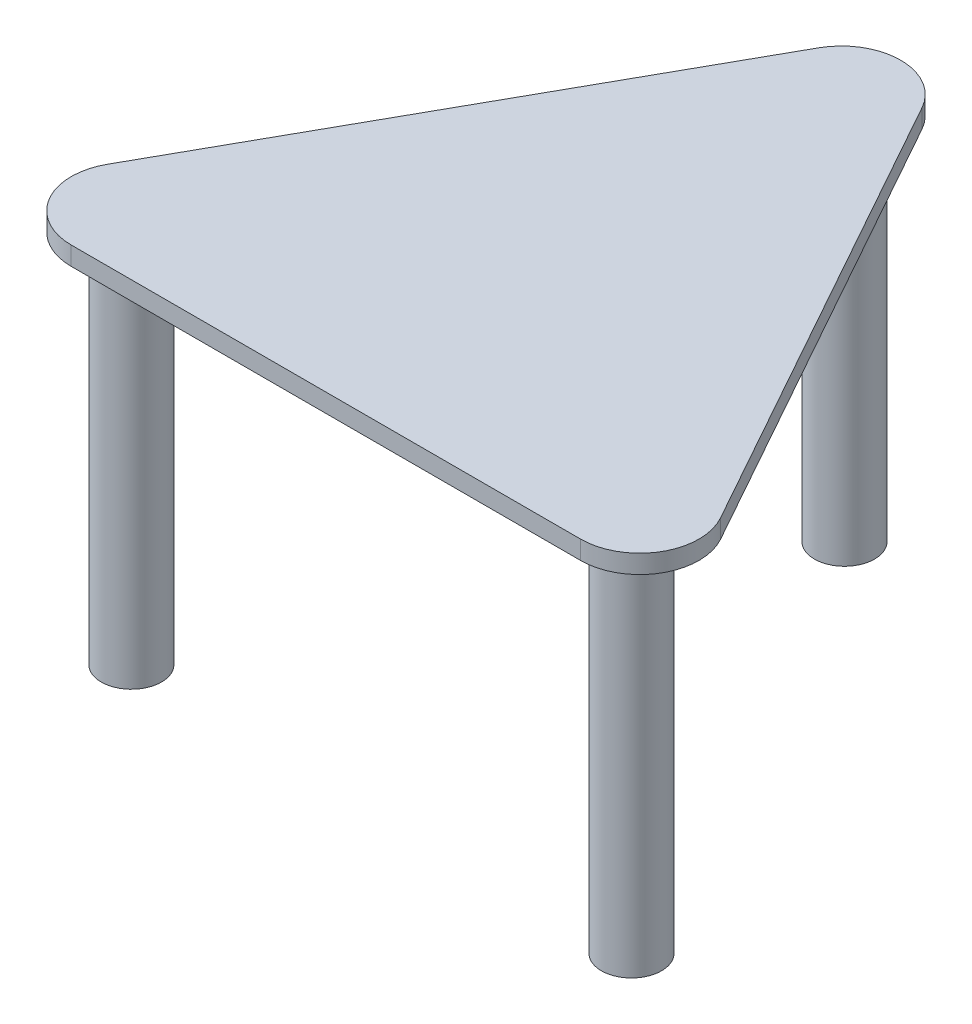
from build123d import *

# Parameters (mm, degrees)
BOSS_EXTRUDE1_DEPTH = 2
SKETCH1_3_R         = 3.25
SKETCH1_3_R_2       = 1.25
BOSS_EXTRUDE2_DEPTH = 40
SKETCH2_W           = 0.284935897
SKETCH2_H           = 2.320192307
BOSS_EXTRUDE3_DEPTH = 1


with BuildPart() as part:
    # Sketch1 → Boss-Extrude1 (new body)
    with BuildSketch(Plane(origin=(0, 0, 0), x_dir=(1, 0, 0), z_dir=(0, 1, 0))):
        with BuildLine():
            ThreePointArc((-35.349263645, 35.611600416), (-40.937728938, 38.892456997), (-46.526194231, 35.611600416))
            Line((-46.526194231, 35.611600416), (-74.024718657, -13.656589181))
            ThreePointArc((-74.024718657, -13.656589181), (-73.955425308, -20.015908685), (-68.436253364, -23.175732601))
            Line((-68.436253364, -23.175732601), (-13.439204511, -23.175732601))
            ThreePointArc((-13.439204511, -23.175732601), (-7.920032568, -20.015908685), (-7.850739218, -13.656589181))
            Line((-7.850739218, -13.656589181), (-35.349263645, 35.611600416))
        make_face()
    extrude(amount=BOSS_EXTRUDE1_DEPTH)

    # Sketch1<3> → Boss-Extrude2 (add)
    # profile 1 of 3: a face of its own
    with BuildSketch(Plane(origin=(0, 0, 0), x_dir=(1, 0, 0), z_dir=(0, 1, 0))):
        with Locations((-13.937728938, -17.175732601)):
            Circle(SKETCH1_3_R)
        with Locations((-13.937728938, -17.175732601)):
            Circle(SKETCH1_3_R_2, mode=Mode.SUBTRACT)
    # profile 2 of 3: a face of its own
    with BuildSketch(Plane(origin=(0, 0, 0), x_dir=(1, 0, 0), z_dir=(0, 1, 0))):
        with Locations((-67.937728938, -17.175732601)):
            Circle(SKETCH1_3_R)
        with Locations((-67.937728938, -17.175732601)):
            Circle(SKETCH1_3_R_2, mode=Mode.SUBTRACT)
    # profile 3 of 3: a face of its own
    with BuildSketch(Plane(origin=(0, 0, 0), x_dir=(1, 0, 0), z_dir=(0, 1, 0))):
        with Locations((-40.937728938, 32.824267399)):
            Circle(SKETCH1_3_R)
        with Locations((-40.937728938, 32.824267399)):
            Circle(SKETCH1_3_R_2, mode=Mode.SUBTRACT)
    extrude(amount=-BOSS_EXTRUDE2_DEPTH)

    # Sketch2 → Boss-Extrude3 (add)
    # profile 1 of 17: a face of its own
    with BuildSketch(Plane.XZ):
        with BuildLine():
            Line((-40.001510989, -2.633112981), (-39.75728022, -2.401602564))
            add(Edge.make_bspline(
                [(-39.75728022, -2.401602564), (-39.712826443, -2.443120614), (-39.625214909, -2.524946281), (-39.483061205, -2.63229787), (-39.334540726, -2.723543655), (-39.180860952, -2.798509022), (-39.024985409, -2.856782239), (-38.870026153, -2.898916848), (-38.717069599, -2.926014547), (-38.615523426, -2.929197561), (-38.565383185, -2.930769231)],
                knots=[0, 0, 0, 0, 1.091957225, 2.152079168, 3.193085318, 4.218301889, 5.218403563, 6.17723952, 7.099979378, 8, 8, 8, 8], degree=3))
            add(Edge.make_bspline(
                [(-38.565383185, -2.930769231), (-38.534617879, -2.930393477), (-38.47316706, -2.929642944), (-38.381886013, -2.920086081), (-38.291574497, -2.906298425), (-38.20254395, -2.886554371), (-38.114440396, -2.860910184), (-38.027459833, -2.829948652), (-37.941770132, -2.792677572), (-37.857822087, -2.75018513), (-37.77602237, -2.703797638), (-37.699089302, -2.652061848), (-37.626702061, -2.596569825), (-37.559372537, -2.536593802), (-37.496178465, -2.473132011), (-37.438276644, -2.405282735), (-37.384400844, -2.334050205), (-37.336566206, -2.258413355), (-37.293330753, -2.18052128), (-37.255892533, -2.100994882), (-37.223656058, -2.020395043), (-37.197897146, -1.938676329), (-37.177187966, -1.855890921), (-37.16252974, -1.772168163), (-37.154296612, -1.687095554), (-37.152869463, -1.630129853), (-37.152152015, -1.601492388)],
                knots=[0, 0, 0, 0, 1.028307134, 2.053947307, 3.065600992, 4.082111276, 5.100671203, 6.132125737, 7.167228006, 8.222953114, 9.277225349, 10.309459149, 11.320441984, 12.324791754, 13.322338422, 14.312705492, 15.305176196, 16.306142747, 17.302479595, 18.282363326, 19.243345101, 20.20291386, 21.145121196, 22.094978082, 23.042318507, 24, 24, 24, 24], degree=3))
            add(Edge.make_bspline(
                [(-37.152152015, -1.601492388), (-37.152844114, -1.57221993), (-37.154226423, -1.513754947), (-37.162891828, -1.426466552), (-37.179516094, -1.340652494), (-37.199822435, -1.255503207), (-37.228565506, -1.17210551), (-37.261978431, -1.089238073), (-37.302266928, -1.007671048), (-37.348660031, -0.927972994), (-37.399929391, -0.850414424), (-37.456307469, -0.776742499), (-37.517900744, -0.707818201), (-37.583576791, -0.642633827), (-37.653934825, -0.581601015), (-37.729657233, -0.525455353), (-37.809684102, -0.473328676), (-37.894050917, -0.425793632), (-37.981865956, -0.383332663), (-38.071905718, -0.345573558), (-38.1644596, -0.314477378), (-38.259040734, -0.289133507), (-38.355536493, -0.268359671), (-38.454436655, -0.254995205), (-38.555014041, -0.245297095), (-38.622812657, -0.244588008), (-38.656969723, -0.244230769)],
                knots=[0, 0, 0, 0, 0.935896426, 1.86923723, 2.799743935, 3.728471844, 4.66505513, 5.616527375, 6.583419551, 7.570341864, 8.562833498, 9.553750335, 10.533080376, 11.5155245, 12.510142773, 13.507781369, 14.526649666, 15.561487327, 16.601173999, 17.643331812, 18.680652164, 19.71969803, 20.772446191, 21.833473655, 22.9085001, 24, 24, 24, 24], degree=3))
            add(Edge.make_bspline(
                [(-38.656969723, -0.244230769), (-38.698134534, -0.245090907), (-38.778968329, -0.246779926), (-38.897789364, -0.259938825), (-39.011919391, -0.28046426), (-39.120986812, -0.310616848), (-39.225387635, -0.348782498), (-39.324736127, -0.395980115), (-39.419309146, -0.451711532), (-39.508687937, -0.514854046), (-39.590782234, -0.58518822), (-39.665401319, -0.660469815), (-39.730358594, -0.741299507), (-39.786077685, -0.827659706), (-39.834035778, -0.918278787), (-39.872291319, -1.014709946), (-39.901880136, -1.115876098), (-39.91398456, -1.185814892), (-39.920100733, -1.221153846)],
                knots=[0, 0, 0, 0, 1.130234505, 2.219399076, 3.279128566, 4.311639422, 5.322903917, 6.328167287, 7.327698761, 8.334124803, 9.329374007, 10.292761544, 11.24113083, 12.171311216, 13.111441694, 14.052040787, 15.015727358, 16, 16, 16, 16], degree=3))
            Line((-39.920100733, -1.221153846), (-38.861767399, -1.221153846))
            Line((-38.861767399, -1.221153846), (-38.861767399, -1.546794872))
            Line((-38.861767399, -1.546794872), (-40.20503663, -1.546794872))
            add(Edge.make_bspline(
                [(-40.20503663, -1.546794872), (-40.203489182, -1.486100221), (-40.200460546, -1.367309826), (-40.179216244, -1.194072509), (-40.144911265, -1.030449616), (-40.098047982, -0.876268829), (-40.037382549, -0.731748642), (-39.963566042, -0.59674232), (-39.875417046, -0.472122045), (-39.776075431, -0.356870449), (-39.664587612, -0.254064664), (-39.543966078, -0.163707849), (-39.414011543, -0.087596191), (-39.274846932, -0.025674018), (-39.126927824, 0.022653106), (-38.969911937, 0.056917322), (-38.804012199, 0.077445931), (-38.690313928, 0.080068825), (-38.632165035, 0.081410256)],
                knots=[0, 0, 0, 0, 1.140356446, 2.231883559, 3.274166699, 4.278491846, 5.25512956, 6.21435461, 7.1637429, 8.11826594, 9.068280886, 10.0076534, 10.945064095, 11.891975133, 12.864533718, 13.863980011, 14.907571808, 16, 16, 16, 16], degree=3))
            add(Edge.make_bspline(
                [(-38.632165035, 0.081410256), (-38.596323698, 0.080893982), (-38.52563303, 0.079875723), (-38.421229117, 0.072639129), (-38.319703847, 0.061498892), (-38.22107201, 0.044675816), (-38.1249708, 0.02407038), (-38.031880176, -0.00231543), (-37.941445525, -0.03285775), (-37.853527066, -0.067597396), (-37.768922799, -0.107848828), (-37.687255887, -0.152579715), (-37.608074901, -0.201559407), (-37.531919202, -0.25563496), (-37.458391988, -0.314401906), (-37.387967364, -0.377978032), (-37.320251075, -0.446168976), (-37.277832654, -0.494591364), (-37.256458906, -0.518990385)],
                knots=[0, 0, 0, 0, 1.107784379, 2.184907829, 3.233506516, 4.263428166, 5.276301166, 6.270063455, 7.25232949, 8.225834625, 9.190232166, 10.146266622, 11.1027726, 12.066435141, 13.031522626, 14.010570082, 14.99756817, 16, 16, 16, 16], degree=3))
            add(Edge.make_bspline(
                [(-37.256458906, -0.518990385), (-37.225447382, -0.557698763), (-37.163939093, -0.634473), (-37.084765337, -0.757481521), (-37.017272636, -0.884846065), (-36.962510397, -1.016921192), (-36.919749419, -1.153583364), (-36.889082318, -1.29465795), (-36.871114277, -1.440326615), (-36.868525711, -1.538901533), (-36.867216117, -1.588772035)],
                knots=[0, 0, 0, 0, 1.023165419, 2.029347347, 3.013907458, 3.994755782, 4.975994455, 5.96558838, 6.970761222, 8, 8, 8, 8], degree=3))
            add(Edge.make_bspline(
                [(-36.867216117, -1.588772035), (-36.867700241, -1.626115315), (-36.868662337, -1.700327263), (-36.880277668, -1.810512168), (-36.897042372, -1.918713334), (-36.9213254, -2.025030945), (-36.953275779, -2.128992998), (-36.991646956, -2.231398331), (-37.036590518, -2.331837636), (-37.089038007, -2.429420693), (-37.14612649, -2.524114129), (-37.21032159, -2.612937451), (-37.278057155, -2.697608132), (-37.352578316, -2.77572898), (-37.431092595, -2.849795643), (-37.515552923, -2.91785595), (-37.604573603, -2.981058206), (-37.698873445, -3.038165646), (-37.79695667, -3.089481048), (-37.898612179, -3.134464445), (-38.003802459, -3.171642465), (-38.111741179, -3.20318717), (-38.22324489, -3.226514498), (-38.337504562, -3.243431568), (-38.455115733, -3.255007257), (-38.534614131, -3.255938217), (-38.574923449, -3.256410256)],
                knots=[0, 0, 0, 0, 1.009025537, 2.005226976, 2.991671811, 3.967589759, 4.950148279, 5.929425679, 6.922109907, 7.921964004, 8.922507644, 9.908469609, 10.882248289, 11.851158214, 12.824245259, 13.798023939, 14.780666017, 15.773333703, 16.775582742, 17.771174102, 18.775387309, 19.789283316, 20.80873549, 21.851817535, 22.910773411, 24, 24, 24, 24], degree=3))
            add(Edge.make_bspline(
                [(-38.574923449, -3.256410256), (-38.607796953, -3.255885888), (-38.672981249, -3.254846128), (-38.769974645, -3.247601828), (-38.865277878, -3.236246934), (-38.959369026, -3.220369016), (-39.051889831, -3.199365104), (-39.143120601, -3.173767414), (-39.232888788, -3.144130235), (-39.321087598, -3.108756683), (-39.408316684, -3.068613714), (-39.495059271, -3.023425441), (-39.581019467, -2.972421436), (-39.666346208, -2.915449628), (-39.751577595, -2.853488678), (-39.83536552, -2.784766415), (-39.919732477, -2.711992915), (-39.973981265, -2.659666934), (-40.001510989, -2.633112981)],
                knots=[0, 0, 0, 0, 0.985875312, 1.954874891, 2.915472732, 3.863573565, 4.815313299, 5.759461513, 6.704487138, 7.649063459, 8.607849844, 9.583336382, 10.581114205, 11.603942397, 12.659508253, 13.739925933, 14.853076422, 16, 16, 16, 16], degree=3))
        make_face()
    # profile 2 of 17: a face of its own
    with BuildSketch(Plane.XZ):
        with BuildLine():
            Line((-40.856318681, -3.175), (-41.478979939, -3.175))
            add(Edge.make_bspline(
                [(-41.478979939, -3.175), (-41.521806976, -3.174952923), (-41.603865479, -3.17486272), (-41.721535565, -3.172127915), (-41.828405822, -3.16847513), (-41.92424581, -3.163411556), (-42.009350414, -3.157427506), (-42.083334535, -3.149034585), (-42.146779704, -3.140271317), (-42.184794841, -3.131361898), (-42.202131983, -3.127298678)],
                knots=[0, 0, 0, 0, 1.415646017, 2.712440637, 3.8905458, 4.950247383, 5.884950622, 6.709939814, 7.411656543, 8, 8, 8, 8], degree=3))
            add(Edge.make_bspline(
                [(-42.202131983, -3.127298678), (-42.224078835, -3.121291442), (-42.267455388, -3.109418524), (-42.329960495, -3.085641554), (-42.389419708, -3.057435855), (-42.44608174, -3.025337271), (-42.498975906, -2.987829956), (-42.549753664, -2.947078705), (-42.597350131, -2.901435441), (-42.641046615, -2.850960257), (-42.681533295, -2.7973067), (-42.715423547, -2.739106633), (-42.745349974, -2.678379041), (-42.768671911, -2.61364124), (-42.787003849, -2.545747762), (-42.80035502, -2.4745219), (-42.808936102, -2.400117305), (-42.809750339, -2.349261248), (-42.810164835, -2.323372396)],
                knots=[0, 0, 0, 0, 0.999333726, 1.975119402, 2.933498163, 3.889020618, 4.832249799, 5.779334906, 6.747801194, 7.724875447, 8.710438469, 9.696133548, 10.679360639, 11.681339199, 12.714023775, 13.766351759, 14.862936069, 16, 16, 16, 16], degree=3))
            add(Edge.make_bspline(
                [(-42.810164835, -2.323372396), (-42.809782543, -2.297266841), (-42.809034562, -2.24618956), (-42.800057217, -2.171465674), (-42.787964829, -2.100056849), (-42.769371074, -2.032121418), (-42.745018214, -1.968062827), (-42.716450423, -1.906902138), (-42.681993935, -1.849679864), (-42.642401839, -1.796188264), (-42.598358607, -1.74637713), (-42.550050585, -1.700607423), (-42.497672798, -1.659147059), (-42.441391707, -1.62190309), (-42.380658629, -1.589739179), (-42.316394676, -1.560930767), (-42.248041265, -1.536736305), (-42.200740556, -1.524009035), (-42.176691277, -1.517538061)],
                knots=[0, 0, 0, 0, 1.121902311, 2.195077645, 3.232258892, 4.234102512, 5.217864754, 6.176164875, 7.132989551, 8.084763148, 9.034132444, 9.988522005, 10.94243251, 11.903244335, 12.886203696, 13.894208494, 14.929344452, 16, 16, 16, 16], degree=3))
            add(Edge.make_bspline(
                [(-42.176691277, -1.517538061), (-42.156799827, -1.513311223), (-42.113206555, -1.504047863), (-42.041417302, -1.493636106), (-41.957790866, -1.485097327), (-41.862611782, -1.477128871), (-41.755658094, -1.472906585), (-41.637175103, -1.467948932), (-41.506761822, -1.465609687), (-41.415802625, -1.465461818), (-41.368312872, -1.465384615)],
                knots=[0, 0, 0, 0, 0.601372724, 1.317943291, 2.144091499, 3.08771165, 4.142394186, 5.309582461, 6.595334295, 8, 8, 8, 8], degree=3))
            Line((-41.368312872, -1.465384615), (-41.141254579, -1.465384615))
            Line((-41.141254579, -1.465384615), (-41.141254579, 0))
            Line((-41.141254579, 0), (-40.856318681, 0))
            Line((-40.856318681, 0), (-40.856318681, -3.175))
        make_face()
        with BuildLine():
            Line((-41.141254579, -2.849358974), (-41.141254579, -1.791025641))
            Line((-41.141254579, -1.791025641), (-41.697133986, -1.784029447))
            add(Edge.make_bspline(
                [(-41.697133986, -1.784029447), (-41.72427609, -1.78401155), (-41.776673362, -1.783977001), (-41.8525672, -1.78765416), (-41.922809658, -1.791654494), (-41.987504446, -1.798123984), (-42.046356278, -1.806014745), (-42.099507644, -1.816564732), (-42.147382718, -1.827325038), (-42.2025295, -1.845996077), (-42.264299679, -1.874163711), (-42.331342199, -1.916235582), (-42.388624534, -1.969235561), (-42.43777553, -2.029470587), (-42.476626034, -2.096550103), (-42.504782679, -2.168122007), (-42.521968911, -2.243914532), (-42.524129075, -2.295722136), (-42.525228938, -2.322100361)],
                knots=[0, 0, 0, 0, 1.160501667, 2.240324542, 3.248665471, 4.168823117, 5.020172044, 5.786515869, 6.485785279, 7.116517804, 8.272762037, 9.381837012, 10.485674779, 11.594342068, 12.695271952, 13.786226926, 14.872841088, 16, 16, 16, 16], degree=3))
            add(Edge.make_bspline(
                [(-42.525228938, -2.322100361), (-42.524080005, -2.347624004), (-42.52179607, -2.398361847), (-42.504924644, -2.472757928), (-42.476327847, -2.543516172), (-42.437743857, -2.610064019), (-42.389770692, -2.670138949), (-42.333627584, -2.721957753), (-42.270188031, -2.763899007), (-42.211635961, -2.791818901), (-42.15923647, -2.808191748), (-42.113941875, -2.820012114), (-42.062539438, -2.828164369), (-42.00551562, -2.835964545), (-41.942943428, -2.842260983), (-41.874424981, -2.846633432), (-41.80018851, -2.849165555), (-41.748653448, -2.84929294), (-41.721938673, -2.849358974)],
                knots=[0, 0, 0, 0, 1.12039168, 2.227199994, 3.330242575, 4.460839274, 5.593542475, 6.693949254, 7.801736126, 8.92216649, 9.528704869, 10.210659466, 10.975987387, 11.81211542, 12.738540127, 13.736887663, 14.826846554, 16, 16, 16, 16], degree=3))
            Line((-41.721938673, -2.849358974), (-41.141254579, -2.849358974))
        make_face(mode=Mode.SUBTRACT)
    # profile 3 of 17: a face of its own
    with BuildSketch(Plane.XZ):
        with BuildLine():
            Line((-43.135805861, -0.612484976), (-43.4042053, -0.773397436))
            add(Edge.make_bspline(
                [(-43.4042053, -0.773397436), (-43.429168272, -0.731610458), (-43.476996364, -0.651548221), (-43.556780811, -0.543364142), (-43.639451381, -0.451414185), (-43.725620276, -0.376233263), (-43.814761529, -0.317043201), (-43.907457063, -0.275131177), (-44.003394506, -0.24899097), (-44.068685044, -0.245815892), (-44.10128062, -0.244230769)],
                knots=[0, 0, 0, 0, 1.272034388, 2.437168799, 3.508375237, 4.49857839, 5.41946034, 6.295179144, 7.148887113, 8, 8, 8, 8], degree=3))
            add(Edge.make_bspline(
                [(-44.10128062, -0.244230769), (-44.129112354, -0.245024523), (-44.184288831, -0.246598143), (-44.265676648, -0.261107727), (-44.344325195, -0.284845299), (-44.419451703, -0.317024422), (-44.489069289, -0.356578588), (-44.551086659, -0.403223773), (-44.603487032, -0.457108573), (-44.646807928, -0.516290124), (-44.680720242, -0.579533065), (-44.704849661, -0.645279892), (-44.720349878, -0.713111649), (-44.722315083, -0.759110766), (-44.723305861, -0.782301683)],
                knots=[0, 0, 0, 0, 1.095645842, 2.172120455, 3.244862764, 4.326153987, 5.384857088, 6.392105572, 7.372507978, 8.334705661, 9.272564127, 10.189475455, 11.087205874, 12, 12, 12, 12], degree=3))
            add(Edge.make_bspline(
                [(-44.723305861, -0.782301683), (-44.721997175, -0.80874542), (-44.719346944, -0.86229687), (-44.695990279, -0.941440927), (-44.66032563, -1.020101336), (-44.626804868, -1.068767031), (-44.609458705, -1.093950321)],
                knots=[0, 0, 0, 0, 0.938992559, 1.901562324, 2.914110574, 4, 4, 4, 4], degree=3))
            add(Edge.make_bspline(
                [(-44.609458705, -1.093950321), (-44.595285553, -1.112175133), (-44.565443451, -1.150548157), (-44.513385, -1.20666466), (-44.454191262, -1.266081679), (-44.38632969, -1.327613262), (-44.310789849, -1.392518085), (-44.226715332, -1.459592409), (-44.135087838, -1.529836622), (-44.070460299, -1.576230904), (-44.03704284, -1.600220353)],
                knots=[0, 0, 0, 0, 0.722283655, 1.520795216, 2.39349503, 3.346893347, 4.386874146, 5.510198126, 6.712579003, 8, 8, 8, 8], degree=3))
            add(Edge.make_bspline(
                [(-44.03704284, -1.600220353), (-44.003642671, -1.624018874), (-43.93978409, -1.669519836), (-43.850410486, -1.736962888), (-43.770597962, -1.799017949), (-43.699939834, -1.854820612), (-43.640264118, -1.906804708), (-43.589389236, -1.952184181), (-43.549192155, -1.993382241), (-43.526823427, -2.020086685), (-43.51678042, -2.032076322)],
                knots=[0, 0, 0, 0, 1.452255772, 2.776602448, 3.96446981, 5.032613149, 5.964194703, 6.766668629, 7.446264616, 8, 8, 8, 8], degree=3))
            add(Edge.make_bspline(
                [(-43.51678042, -2.032076322), (-43.502746964, -2.050765333), (-43.475148288, -2.087519782), (-43.43867846, -2.144951255), (-43.407923354, -2.203629868), (-43.383171244, -2.263768287), (-43.36315515, -2.324914535), (-43.349238831, -2.387527674), (-43.340661105, -2.451182649), (-43.339775051, -2.494010556), (-43.339331502, -2.51544972)],
                knots=[0, 0, 0, 0, 1.068019517, 2.100403715, 3.106014851, 4.09224787, 5.069873182, 6.043214339, 7.020455327, 8, 8, 8, 8], degree=3))
            add(Edge.make_bspline(
                [(-43.339331502, -2.51544972), (-43.340510295, -2.549043893), (-43.342842687, -2.615514189), (-43.362730853, -2.712564684), (-43.393751039, -2.805509219), (-43.438630137, -2.892279183), (-43.494064219, -2.972751576), (-43.55986458, -3.045498884), (-43.637263474, -3.108017057), (-43.72342821, -3.161162502), (-43.816640695, -3.203560713), (-43.914601549, -3.234454706), (-44.01687059, -3.252560472), (-44.0863692, -3.255114386), (-44.121633185, -3.256410256)],
                knots=[0, 0, 0, 0, 1.005367131, 1.989245246, 2.955191616, 3.932180104, 4.904534562, 5.875498653, 6.859376768, 7.874484044, 8.900379497, 9.918679785, 10.943926428, 12, 12, 12, 12], degree=3))
            add(Edge.make_bspline(
                [(-44.121633185, -3.256410256), (-44.159059038, -3.255161392), (-44.233278981, -3.252684746), (-44.342484942, -3.229826556), (-44.44825584, -3.194310897), (-44.533022914, -3.152012432), (-44.599390043, -3.110221615), (-44.649948891, -3.07206033), (-44.701462324, -3.028222277), (-44.753375306, -2.977778761), (-44.806200748, -2.921740037), (-44.8596952, -2.859631337), (-44.914359314, -2.792012477), (-44.94951444, -2.743728186), (-44.96753663, -2.718975361)],
                knots=[0, 0, 0, 0, 1.286534051, 2.551350862, 3.822568981, 5.117864672, 5.799956111, 6.519305446, 7.295594771, 8.126302591, 9.008831062, 9.944975596, 10.946496709, 12, 12, 12, 12], degree=3))
            Line((-44.96753663, -2.718975361), (-44.709949491, -2.523717949))
            add(Edge.make_bspline(
                [(-44.709949491, -2.523717949), (-44.694396815, -2.543756707), (-44.664445997, -2.582346669), (-44.618956304, -2.63637093), (-44.576146154, -2.685786748), (-44.533645003, -2.728595243), (-44.494728976, -2.76800256), (-44.456287442, -2.801141703), (-44.419805454, -2.82906474), (-44.373925292, -2.858902893), (-44.315657357, -2.887771526), (-44.243195681, -2.912591669), (-44.167421193, -2.927845119), (-44.115979567, -2.929783812), (-44.089832303, -2.930769231)],
                knots=[0, 0, 0, 0, 1.181426797, 2.275151783, 3.28963443, 4.225459815, 5.084396437, 5.868484344, 6.587427557, 7.222918358, 8.415355282, 9.605213164, 10.782753814, 12, 12, 12, 12], degree=3))
            add(Edge.make_bspline(
                [(-44.089832303, -2.930769231), (-44.057025432, -2.929688044), (-43.993760471, -2.927603078), (-43.904152001, -2.904232925), (-43.823033974, -2.868700181), (-43.753503056, -2.817462336), (-43.696092456, -2.756376955), (-43.654048475, -2.68671338), (-43.628911117, -2.609772672), (-43.625834348, -2.556126979), (-43.624267399, -2.52880609)],
                knots=[0, 0, 0, 0, 1.144248881, 2.206576175, 3.214949548, 4.222996039, 5.203671638, 6.127710127, 7.046472867, 8, 8, 8, 8], degree=3))
            add(Edge.make_bspline(
                [(-43.624267399, -2.52880609), (-43.624661246, -2.511804191), (-43.625454427, -2.477563549), (-43.634911065, -2.427079329), (-43.649023114, -2.377189424), (-43.669026555, -2.327606397), (-43.696211467, -2.27691767), (-43.73313335, -2.225412158), (-43.779336198, -2.171800813), (-43.814795667, -2.136966296), (-43.833517199, -2.11857472)],
                knots=[0, 0, 0, 0, 0.858500039, 1.728959331, 2.587258638, 3.476905708, 4.426389682, 5.487945037, 6.673710648, 8, 8, 8, 8], degree=3))
            add(Edge.make_bspline(
                [(-43.833517199, -2.11857472), (-43.840467158, -2.11237256), (-43.856978671, -2.09763765), (-43.887164689, -2.073514653), (-43.927027084, -2.043757852), (-43.975524938, -2.006939358), (-44.033552474, -1.964229746), (-44.101116071, -1.916175112), (-44.177462604, -1.861215445), (-44.231638914, -1.822791105), (-44.260285027, -1.802473958)],
                knots=[0, 0, 0, 0, 0.420754252, 0.999615792, 1.744751191, 2.668019286, 3.750313428, 4.999500688, 6.413464383, 8, 8, 8, 8], degree=3))
            add(Edge.make_bspline(
                [(-44.260285027, -1.802473958), (-44.294743653, -1.777399279), (-44.361468006, -1.728845637), (-44.456407711, -1.655897367), (-44.542488825, -1.584551785), (-44.620019942, -1.51526914), (-44.689745683, -1.448559477), (-44.750963173, -1.383671938), (-44.803950169, -1.321032045), (-44.861773497, -1.241269918), (-44.920157918, -1.142401842), (-44.970217761, -1.021215199), (-45.002064975, -0.899680788), (-45.00620105, -0.818100612), (-45.008241758, -0.777849559)],
                knots=[0, 0, 0, 0, 1.163604038, 2.253157948, 3.268574773, 4.215621239, 5.091738613, 5.902582348, 6.650434646, 7.330118262, 8.591011492, 9.77460283, 10.902005569, 12, 12, 12, 12], degree=3))
            add(Edge.make_bspline(
                [(-45.008241758, -0.777849559), (-45.007644701, -0.749385426), (-45.006462181, -0.693009912), (-44.992904149, -0.610220872), (-44.9729691, -0.529848461), (-44.943258308, -0.452892879), (-44.906118954, -0.37849645), (-44.860902088, -0.306789617), (-44.806104394, -0.238950603), (-44.745230731, -0.173661953), (-44.677615493, -0.114614824), (-44.606064766, -0.062022474), (-44.530980147, -0.01699173), (-44.451504184, 0.018385422), (-44.368946063, 0.046684119), (-44.282918247, 0.06696788), (-44.193235882, 0.079459274), (-44.132274564, 0.080752669), (-44.10128062, 0.081410256)],
                knots=[0, 0, 0, 0, 0.98378539, 1.948466333, 2.894822735, 3.844243623, 4.795447569, 5.768042124, 6.770299647, 7.807997672, 8.852593179, 9.870666288, 10.876941106, 11.874841786, 12.874492863, 13.892063892, 14.928283473, 16, 16, 16, 16], degree=3))
            add(Edge.make_bspline(
                [(-44.10128062, 0.081410256), (-44.077301046, 0.080941228), (-44.029643896, 0.080009079), (-43.959342412, 0.07196351), (-43.890331882, 0.060164582), (-43.823478794, 0.042175506), (-43.757950783, 0.019835875), (-43.694331657, -0.007515565), (-43.632467947, -0.040076834), (-43.572283235, -0.077898299), (-43.513226659, -0.121497566), (-43.455536565, -0.171837516), (-43.398924158, -0.228677189), (-43.343154277, -0.291937488), (-43.289540651, -0.36266406), (-43.236735059, -0.439735266), (-43.185012461, -0.523400093), (-43.152514419, -0.582235375), (-43.135805861, -0.612484976)],
                knots=[0, 0, 0, 0, 0.915366252, 1.81920441, 2.69897508, 3.586533125, 4.459536084, 5.340758185, 6.227946952, 7.126403341, 8.052553006, 9.028121456, 10.047063623, 11.114014537, 12.24582441, 13.433687931, 14.680555077, 16, 16, 16, 16], degree=3))
        make_face()
    # profile 4 of 17: a face of its own
    with BuildSketch(Plane.XZ):
        Polygon((-26.568818681, 2.994551282), (-26.853754579, 2.994551282), (-26.853754579, 3.930769231), (-27.260805861, 3.930769231), (-27.260805861, 4.215705128), (-26.853754579, 4.215705128), (-26.853754579, 6.250961538), (-26.568818681, 6.250961538), (-26.568818681, 4.215705128), (-26.161767399, 4.215705128), (-26.161767399, 3.930769231), (-26.568818681, 3.930769231), align=None)
    # profile 5 of 17: a face of its own
    with BuildSketch(Plane.XZ):
        with BuildLine():
            Line((-27.789972527, 2.994551282), (-28.074908425, 2.994551282))
            Line((-28.074908425, 2.994551282), (-28.074908425, 4.368985377))
            add(Edge.make_bspline(
                [(-28.074908425, 4.368985377), (-28.105543536, 4.330807923), (-28.16509702, 4.256592414), (-28.264652204, 4.158712502), (-28.368389434, 4.075342094), (-28.477189061, 4.007262162), (-28.590588683, 3.954448671), (-28.708866951, 3.917500051), (-28.831722323, 3.894459711), (-28.915411241, 3.891539661), (-28.957700893, 3.890064103)],
                knots=[0, 0, 0, 0, 1.12556596, 2.18805719, 3.205172764, 4.182516927, 5.13416184, 6.075333115, 7.027428072, 8, 8, 8, 8], degree=3))
            add(Edge.make_bspline(
                [(-28.957700893, 3.890064103), (-29.000657029, 3.891557813), (-29.084774694, 3.89448283), (-29.206808817, 3.920255936), (-29.321582553, 3.961042322), (-29.42756275, 4.018364576), (-29.523112939, 4.089537409), (-29.605987274, 4.173010883), (-29.675509661, 4.267685574), (-29.722025289, 4.355933438), (-29.75251172, 4.434411313), (-29.771782986, 4.501760339), (-29.788131165, 4.576799128), (-29.802372396, 4.659499117), (-29.811864564, 4.750254211), (-29.819488692, 4.848655907), (-29.824910208, 4.954698278), (-29.825120303, 5.028104506), (-29.825228938, 5.066060697)],
                knots=[0, 0, 0, 0, 1.235689485, 2.419754739, 3.574485241, 4.732583367, 5.875375667, 6.993392835, 8.106934443, 9.24564317, 9.854426656, 10.528623913, 11.260290605, 12.06517837, 12.94359002, 13.886555271, 14.907200199, 16, 16, 16, 16], degree=3))
            Line((-29.825228938, 5.066060697), (-29.825228938, 6.250961538))
            Line((-29.825228938, 6.250961538), (-29.54029304, 6.250961538))
            Line((-29.54029304, 6.250961538), (-29.54029304, 5.159555288))
            add(Edge.make_bspline(
                [(-29.54029304, 5.159555288), (-29.540121098, 5.127966112), (-29.539792203, 5.067541393), (-29.53869164, 4.981031236), (-29.536290716, 4.902776778), (-29.532267502, 4.832615576), (-29.528219207, 4.770642713), (-29.522479782, 4.716756964), (-29.515851933, 4.671296369), (-29.509892727, 4.643932767), (-29.507220124, 4.631660657)],
                knots=[0, 0, 0, 0, 1.430934443, 2.737134061, 3.918973087, 4.976914145, 5.92044225, 6.731742364, 7.431207999, 8, 8, 8, 8], degree=3))
            add(Edge.make_bspline(
                [(-29.507220124, 4.631660657), (-29.496904815, 4.595625855), (-29.477126084, 4.52653218), (-29.430235688, 4.432845741), (-29.37303275, 4.352243772), (-29.30213032, 4.287015611), (-29.219883805, 4.235619819), (-29.125512381, 4.200603838), (-29.020221946, 4.178273766), (-28.946164102, 4.176123764), (-28.9074555, 4.175)],
                knots=[0, 0, 0, 0, 1.090171874, 2.090312098, 3.036871164, 3.954896932, 4.878889889, 5.844924892, 6.87358393, 8, 8, 8, 8], degree=3))
            add(Edge.make_bspline(
                [(-28.9074555, 4.175), (-28.884531982, 4.175425429), (-28.839166933, 4.176267343), (-28.771933216, 4.184933976), (-28.706510843, 4.198621753), (-28.643075407, 4.21883982), (-28.581497507, 4.243421167), (-28.521526837, 4.273587396), (-28.463984131, 4.310061615), (-28.408126681, 4.351112985), (-28.356128887, 4.396526653), (-28.307754248, 4.444468139), (-28.264630006, 4.495517114), (-28.225560688, 4.54885734), (-28.19183466, 4.60521972), (-28.162395081, 4.664060932), (-28.13741627, 4.725458305), (-28.125004114, 4.768071397), (-28.118793641, 4.789393029)],
                knots=[0, 0, 0, 0, 1.024369801, 2.02720137, 3.025498567, 4.008789058, 4.999724648, 5.987391013, 7.005161842, 8.042127274, 9.083588116, 10.088924978, 11.084112559, 12.068088063, 13.041783903, 14.016724555, 15.007660144, 16, 16, 16, 16], degree=3))
            add(Edge.make_bspline(
                [(-28.118793641, 4.789393029), (-28.115220018, 4.804833463), (-28.107432653, 4.838480069), (-28.098982769, 4.89397392), (-28.091419196, 4.958459415), (-28.085025154, 5.031838745), (-28.081103497, 5.1143808), (-28.076877808, 5.205522313), (-28.075304809, 5.305834189), (-28.075044502, 5.3755894), (-28.074908425, 5.412054287)],
                knots=[0, 0, 0, 0, 0.607992626, 1.324890765, 2.152360218, 3.099583803, 4.150613268, 5.323148443, 6.60066238, 8, 8, 8, 8], degree=3))
            Line((-28.074908425, 5.412054287), (-28.074908425, 6.250961538))
            Line((-28.074908425, 6.250961538), (-27.789972527, 6.250961538))
            Line((-27.789972527, 6.250961538), (-27.789972527, 2.994551282))
        make_face()
    # profile 6 of 17: a face of its own
    with BuildSketch(Plane.XZ):
        with BuildLine():
            add(Edge.make_bspline(
                [(-30.577001774, 2.953846154), (-30.59468023, 2.954669907), (-30.629298042, 2.956282974), (-30.679408153, 2.969986065), (-30.72499099, 2.993567945), (-30.766025226, 3.0241778), (-30.800040722, 3.061656515), (-30.824431643, 3.104240619), (-30.840002732, 3.150600046), (-30.841894137, 3.182902307), (-30.842857143, 3.199348958)],
                knots=[0, 0, 0, 0, 1.054986045, 2.065865298, 3.074122704, 4.105114675, 5.109626121, 6.074217918, 7.019490725, 8, 8, 8, 8], degree=3))
            add(Edge.make_bspline(
                [(-30.842857143, 3.199348958), (-30.841872594, 3.215368706), (-30.839926257, 3.247037851), (-30.824443153, 3.292593464), (-30.799836233, 3.334584594), (-30.766047867, 3.371990035), (-30.724985011, 3.402582207), (-30.679409735, 3.426168759), (-30.629297625, 3.439870615), (-30.594680089, 3.441483852), (-30.577001774, 3.442307692)],
                knots=[0, 0, 0, 0, 0.961106377, 1.899993565, 2.859409042, 3.870007927, 4.90724781, 5.921615355, 6.938620636, 8, 8, 8, 8], degree=3))
            add(Edge.make_bspline(
                [(-30.577001774, 3.442307692), (-30.559526499, 3.441510311), (-30.525513158, 3.439958313), (-30.476324424, 3.426004828), (-30.431475031, 3.402633498), (-30.391111858, 3.37156668), (-30.35665359, 3.334833315), (-30.332137462, 3.292561745), (-30.316612962, 3.247045926), (-30.314672203, 3.215371419), (-30.313690476, 3.199348958)],
                knots=[0, 0, 0, 0, 1.055304112, 2.054011575, 3.063363921, 4.096942562, 5.122536081, 6.088009498, 7.032825006, 8, 8, 8, 8], degree=3))
            add(Edge.make_bspline(
                [(-30.313690476, 3.199348958), (-30.314650555, 3.182899491), (-30.316536211, 3.1505917), (-30.332149511, 3.10427288), (-30.356446578, 3.061405671), (-30.391134123, 3.024600848), (-30.431469202, 2.993516767), (-30.476325942, 2.970149951), (-30.525512755, 2.956195286), (-30.559526362, 2.954643451), (-30.577001774, 2.953846154)],
                knots=[0, 0, 0, 0, 0.986662878, 1.937868148, 2.908513651, 3.927890639, 4.955204348, 5.958438607, 6.951092507, 8, 8, 8, 8], degree=3))
        make_face()
    # profile 7 of 17: a face of its own
    with BuildSketch(Plane.XZ):
        with Locations((-30.57827381, 5.090865385)):
            Rectangle(SKETCH2_W, SKETCH2_H)
    # profile 8 of 17: a face of its own
    with BuildSketch(Plane.XZ):
        with BuildLine():
            Line((-32.471062271, 4.220157252), (-32.277712912, 4.419230769))
            add(Edge.make_bspline(
                [(-32.277712912, 4.419230769), (-32.261032835, 4.399892521), (-32.22887561, 4.362610654), (-32.177829106, 4.312830657), (-32.126996667, 4.270677514), (-32.076646396, 4.23599269), (-32.026684332, 4.208695414), (-31.976683895, 4.189415634), (-31.926782293, 4.177311859), (-31.893409425, 4.175761364), (-31.877021806, 4.175)],
                knots=[0, 0, 0, 0, 1.265880991, 2.440469525, 3.530740057, 4.536711111, 5.468008477, 6.34654737, 7.188078389, 8, 8, 8, 8], degree=3))
            add(Edge.make_bspline(
                [(-31.877021806, 4.175), (-31.856946011, 4.175987112), (-31.817439686, 4.177929608), (-31.760874241, 4.1968489), (-31.709003822, 4.226716358), (-31.663099696, 4.267439819), (-31.624773497, 4.315698727), (-31.596047184, 4.369204118), (-31.57885728, 4.427097757), (-31.576662579, 4.467030955), (-31.575549451, 4.487284655)],
                knots=[0, 0, 0, 0, 0.999905305, 1.967672129, 2.944835807, 3.972828834, 5.013019963, 6.007753697, 6.989553527, 8, 8, 8, 8], degree=3))
            add(Edge.make_bspline(
                [(-31.575549451, 4.487284655), (-31.576557116, 4.505619867), (-31.578569606, 4.542238603), (-31.594214808, 4.596257177), (-31.619130459, 4.648923204), (-31.642416993, 4.681183841), (-31.654415636, 4.69780649)],
                knots=[0, 0, 0, 0, 0.960159726, 1.917612774, 2.927026955, 4, 4, 4, 4], degree=3))
            add(Edge.make_bspline(
                [(-31.654415636, 4.69780649), (-31.661676823, 4.706643191), (-31.677224922, 4.725564878), (-31.705426372, 4.752493014), (-31.738833855, 4.780650075), (-31.777764543, 4.809845035), (-31.822296688, 4.840108477), (-31.871777673, 4.871954486), (-31.926819047, 4.904450851), (-31.965582299, 4.925816194), (-31.985780821, 4.936949119)],
                knots=[0, 0, 0, 0, 0.667332049, 1.428932371, 2.272176193, 3.217953793, 4.268659351, 5.415594948, 6.6533338, 8, 8, 8, 8], degree=3))
            add(Edge.make_bspline(
                [(-31.985780821, 4.936949119), (-32.010471841, 4.950772608), (-32.058166762, 4.977475037), (-32.125864312, 5.01901853), (-32.187666417, 5.060032236), (-32.242719752, 5.101453885), (-32.292315209, 5.141579619), (-32.335655839, 5.181518689), (-32.372875877, 5.221376661), (-32.393693806, 5.24926163), (-32.403644402, 5.262590144)],
                knots=[0, 0, 0, 0, 1.271974443, 2.457035787, 3.569878245, 4.604907449, 5.553098313, 6.436573686, 7.252710343, 8, 8, 8, 8], degree=3))
            add(Edge.make_bspline(
                [(-32.403644402, 5.262590144), (-32.420271186, 5.289463652), (-32.453425222, 5.343049798), (-32.486310674, 5.431780523), (-32.507926655, 5.524862645), (-32.510470575, 5.588740706), (-32.511767399, 5.621304087)],
                knots=[0, 0, 0, 0, 0.995678878, 1.985397446, 2.973007791, 4, 4, 4, 4], degree=3))
            add(Edge.make_bspline(
                [(-32.511767399, 5.621304087), (-32.511116124, 5.644227514), (-32.509832716, 5.689400633), (-32.500869301, 5.755915721), (-32.485564961, 5.819574839), (-32.464366327, 5.880762769), (-32.437131228, 5.939314659), (-32.403181282, 5.994815881), (-32.363123539, 6.047255412), (-32.318518216, 6.097320908), (-32.268703186, 6.142810621), (-32.214924865, 6.182201652), (-32.1588056, 6.216470856), (-32.099111815, 6.24372229), (-32.036593502, 6.265623401), (-31.970894692, 6.280720073), (-31.902291718, 6.289771862), (-31.855637105, 6.291027079), (-31.831864555, 6.291666667)],
                knots=[0, 0, 0, 0, 1.032810722, 2.035266353, 3.017676364, 3.978389067, 4.948507077, 5.921677479, 6.903715858, 7.918386526, 8.939467451, 9.936812204, 10.918153393, 11.89693397, 12.887853058, 13.89815236, 14.929017384, 16, 16, 16, 16], degree=3))
            add(Edge.make_bspline(
                [(-31.831864555, 6.291666667), (-31.799779882, 6.290770224), (-31.73605635, 6.288989796), (-31.64183703, 6.272141964), (-31.549576153, 6.246228916), (-31.46059935, 6.209284029), (-31.376265885, 6.163863678), (-31.298649052, 6.110124026), (-31.228556404, 6.048349142), (-31.18851758, 6.00109902), (-31.168498168, 5.977473958)],
                knots=[0, 0, 0, 0, 1.014105853, 2.01412079, 3.018242674, 4.040740662, 5.055023907, 6.042888753, 7.021444376, 8, 8, 8, 8], degree=3))
            Line((-31.168498168, 5.977473958), (-31.357395404, 5.7625))
            add(Edge.make_bspline(
                [(-31.357395404, 5.7625), (-31.375331807, 5.781871822), (-31.410104237, 5.819427028), (-31.465713198, 5.86943268), (-31.522300226, 5.911343833), (-31.579300263, 5.946398931), (-31.637557063, 5.973409475), (-31.696744156, 5.992385628), (-31.756741155, 6.004581431), (-31.797038378, 6.006013159), (-31.817236149, 6.006730769)],
                knots=[0, 0, 0, 0, 1.179806542, 2.287233372, 3.337373186, 4.324005949, 5.273901747, 6.200048787, 7.097828587, 8, 8, 8, 8], degree=3))
            add(Edge.make_bspline(
                [(-31.817236149, 6.006730769), (-31.844738636, 6.005487124), (-31.898473881, 6.003057251), (-31.975442151, 5.980999733), (-32.046495762, 5.946404583), (-32.108243464, 5.897364266), (-32.160497949, 5.840309474), (-32.199098143, 5.776275655), (-32.222487082, 5.706407471), (-32.225370535, 5.657943699), (-32.226831502, 5.633388421)],
                knots=[0, 0, 0, 0, 1.072236613, 2.094970478, 3.102399718, 4.141104368, 5.155589565, 6.110053346, 7.042415349, 8, 8, 8, 8], degree=3))
            add(Edge.make_bspline(
                [(-32.226831502, 5.633388421), (-32.225876502, 5.613141394), (-32.224000684, 5.573372039), (-32.208350446, 5.515674026), (-32.184679577, 5.460629454), (-32.160736678, 5.428393119), (-32.148601334, 5.412054287)],
                knots=[0, 0, 0, 0, 1.014054094, 1.991812201, 2.982159616, 4, 4, 4, 4], degree=3))
            add(Edge.make_bspline(
                [(-32.148601334, 5.412054287), (-32.141325451, 5.403855675), (-32.12547595, 5.385996137), (-32.096366392, 5.360254591), (-32.061789305, 5.332331543), (-32.020208924, 5.303916199), (-31.973723109, 5.272437605), (-31.919849039, 5.241220988), (-31.860674765, 5.207174971), (-31.818782199, 5.184673771), (-31.796883585, 5.172911659)],
                knots=[0, 0, 0, 0, 0.615029206, 1.339755737, 2.178261527, 3.109653826, 4.166232585, 5.329982127, 6.604294388, 8, 8, 8, 8], degree=3))
            add(Edge.make_bspline(
                [(-31.796883585, 5.172911659), (-31.773255562, 5.159722589), (-31.727433284, 5.134144774), (-31.66252967, 5.094306616), (-31.603975998, 5.053787017), (-31.550363334, 5.014858941), (-31.503045851, 4.975469942), (-31.462209955, 4.935576292), (-31.426247895, 4.896786877), (-31.406338457, 4.8693029), (-31.396828497, 4.85617488)],
                knots=[0, 0, 0, 0, 1.262093308, 2.447601706, 3.550203992, 4.582594899, 5.537233252, 6.418365656, 7.244515135, 8, 8, 8, 8], degree=3))
            add(Edge.make_bspline(
                [(-31.396828497, 4.85617488), (-31.380405289, 4.829727384), (-31.347657904, 4.77699187), (-31.315296635, 4.688860676), (-31.293666091, 4.595827805), (-31.291644054, 4.531511049), (-31.290613553, 4.498732973)],
                knots=[0, 0, 0, 0, 0.984940175, 1.963941237, 2.962352981, 4, 4, 4, 4], degree=3))
            add(Edge.make_bspline(
                [(-31.290613553, 4.498732973), (-31.291097572, 4.477301128), (-31.292044865, 4.435355971), (-31.299622176, 4.373729049), (-31.313373801, 4.315162634), (-31.330823218, 4.258662752), (-31.354568142, 4.205268101), (-31.383355216, 4.154423427), (-31.417826915, 4.106952689), (-31.456615381, 4.062530451), (-31.498761194, 4.02173395), (-31.544965577, 3.986835999), (-31.59330315, 3.956571286), (-31.644831289, 3.932332072), (-31.698891836, 3.91306834), (-31.755905888, 3.9000201), (-31.8154792, 3.891243197), (-31.85621217, 3.890462794), (-31.877021806, 3.890064103)],
                knots=[0, 0, 0, 0, 1.087410352, 2.12821612, 3.143409386, 4.13688077, 5.124334423, 6.102425883, 7.096654197, 8.095527921, 9.09231389, 10.067027194, 11.028349958, 11.981147348, 12.950860869, 13.934615631, 14.944837612, 16, 16, 16, 16], degree=3))
            add(Edge.make_bspline(
                [(-31.877021806, 3.890064103), (-31.901690103, 3.891063552), (-31.951489448, 3.8930812), (-32.026177976, 3.909179372), (-32.100671876, 3.935395616), (-32.175047498, 3.97245389), (-32.249621714, 4.01906456), (-32.324060254, 4.076435943), (-32.399572514, 4.142948596), (-32.446699905, 4.193845992), (-32.471062271, 4.220157252)],
                knots=[0, 0, 0, 0, 0.845753203, 1.707371858, 2.609134499, 3.549244224, 4.552329203, 5.621587647, 6.770486714, 8, 8, 8, 8], degree=3))
        make_face()
    # profile 9 of 17: a face of its own
    with BuildSketch(Plane.XZ):
        with BuildLine():
            Line((-35.401831502, 4.220157252), (-35.208482143, 4.419230769))
            add(Edge.make_bspline(
                [(-35.208482143, 4.419230769), (-35.191802066, 4.399892521), (-35.159644841, 4.362610654), (-35.108598337, 4.312830657), (-35.057765897, 4.270677514), (-35.007415626, 4.23599269), (-34.957453563, 4.208695414), (-34.907453126, 4.189415634), (-34.857551523, 4.177311859), (-34.824178656, 4.175761364), (-34.807791037, 4.175)],
                knots=[0, 0, 0, 0, 1.265880991, 2.440469525, 3.530740057, 4.536711111, 5.468008477, 6.34654737, 7.188078389, 8, 8, 8, 8], degree=3))
            add(Edge.make_bspline(
                [(-34.807791037, 4.175), (-34.787715241, 4.175987112), (-34.748208917, 4.177929608), (-34.691643472, 4.1968489), (-34.639773052, 4.226716358), (-34.593868927, 4.267439819), (-34.555542728, 4.315698727), (-34.526816414, 4.369204118), (-34.50962651, 4.427097757), (-34.50743181, 4.467030955), (-34.506318681, 4.487284655)],
                knots=[0, 0, 0, 0, 0.999905305, 1.967672129, 2.944835807, 3.972828834, 5.013019963, 6.007753697, 6.989553527, 8, 8, 8, 8], degree=3))
            add(Edge.make_bspline(
                [(-34.506318681, 4.487284655), (-34.507326347, 4.505619867), (-34.509338837, 4.542238603), (-34.524984039, 4.596257177), (-34.54989969, 4.648923204), (-34.573186223, 4.681183841), (-34.585184867, 4.69780649)],
                knots=[0, 0, 0, 0, 0.960159726, 1.917612774, 2.927026955, 4, 4, 4, 4], degree=3))
            add(Edge.make_bspline(
                [(-34.585184867, 4.69780649), (-34.592446054, 4.706643191), (-34.607994153, 4.725564878), (-34.636195603, 4.752493014), (-34.669603085, 4.780650075), (-34.708533774, 4.809845035), (-34.753065919, 4.840108477), (-34.802546904, 4.871954486), (-34.857588277, 4.904450851), (-34.89635153, 4.925816194), (-34.916550052, 4.936949119)],
                knots=[0, 0, 0, 0, 0.667332049, 1.428932371, 2.272176193, 3.217953793, 4.268659351, 5.415594948, 6.6533338, 8, 8, 8, 8], degree=3))
            add(Edge.make_bspline(
                [(-34.916550052, 4.936949119), (-34.941241072, 4.950772608), (-34.988935993, 4.977475037), (-35.056633543, 5.01901853), (-35.118435648, 5.060032236), (-35.173488983, 5.101453885), (-35.22308444, 5.141579619), (-35.26642507, 5.181518689), (-35.303645107, 5.221376661), (-35.324463037, 5.24926163), (-35.334413633, 5.262590144)],
                knots=[0, 0, 0, 0, 1.271974443, 2.457035787, 3.569878245, 4.604907449, 5.553098313, 6.436573686, 7.252710343, 8, 8, 8, 8], degree=3))
            add(Edge.make_bspline(
                [(-35.334413633, 5.262590144), (-35.351040417, 5.289463652), (-35.384194453, 5.343049798), (-35.417079905, 5.431780523), (-35.438695886, 5.524862645), (-35.441239806, 5.588740706), (-35.44253663, 5.621304087)],
                knots=[0, 0, 0, 0, 0.995678878, 1.985397446, 2.973007791, 4, 4, 4, 4], degree=3))
            add(Edge.make_bspline(
                [(-35.44253663, 5.621304087), (-35.441885355, 5.644227514), (-35.440601947, 5.689400633), (-35.431638532, 5.755915721), (-35.416334192, 5.819574839), (-35.395135557, 5.880762769), (-35.367900459, 5.939314659), (-35.333950513, 5.994815881), (-35.29389277, 6.047255412), (-35.249287447, 6.097320908), (-35.199472416, 6.142810621), (-35.145694095, 6.182201652), (-35.08957483, 6.216470856), (-35.029881046, 6.24372229), (-34.967362733, 6.265623401), (-34.901663923, 6.280720073), (-34.833060949, 6.289771862), (-34.786406336, 6.291027079), (-34.762633785, 6.291666667)],
                knots=[0, 0, 0, 0, 1.032810722, 2.035266353, 3.017676364, 3.978389067, 4.948507077, 5.921677479, 6.903715858, 7.918386526, 8.939467451, 9.936812204, 10.918153393, 11.89693397, 12.887853058, 13.89815236, 14.929017384, 16, 16, 16, 16], degree=3))
            add(Edge.make_bspline(
                [(-34.762633785, 6.291666667), (-34.730549113, 6.290770224), (-34.666825581, 6.288989796), (-34.57260626, 6.272141964), (-34.480345384, 6.246228916), (-34.391368581, 6.209284029), (-34.307035115, 6.163863678), (-34.229418283, 6.110124026), (-34.159325635, 6.048349142), (-34.119286811, 6.00109902), (-34.099267399, 5.977473958)],
                knots=[0, 0, 0, 0, 1.014105853, 2.01412079, 3.018242674, 4.040740662, 5.055023907, 6.042888753, 7.021444376, 8, 8, 8, 8], degree=3))
            Line((-34.099267399, 5.977473958), (-34.288164635, 5.7625))
            add(Edge.make_bspline(
                [(-34.288164635, 5.7625), (-34.306101038, 5.781871822), (-34.340873468, 5.819427028), (-34.396482429, 5.86943268), (-34.453069457, 5.911343833), (-34.510069494, 5.946398931), (-34.568326294, 5.973409475), (-34.627513387, 5.992385628), (-34.687510386, 6.004581431), (-34.727807609, 6.006013159), (-34.74800538, 6.006730769)],
                knots=[0, 0, 0, 0, 1.179806542, 2.287233372, 3.337373186, 4.324005949, 5.273901747, 6.200048787, 7.097828587, 8, 8, 8, 8], degree=3))
            add(Edge.make_bspline(
                [(-34.74800538, 6.006730769), (-34.775507867, 6.005487124), (-34.829243112, 6.003057251), (-34.906211382, 5.980999733), (-34.977264993, 5.946404583), (-35.039012695, 5.897364266), (-35.09126718, 5.840309474), (-35.129867374, 5.776275655), (-35.153256312, 5.706407471), (-35.156139765, 5.657943699), (-35.157600733, 5.633388421)],
                knots=[0, 0, 0, 0, 1.072236613, 2.094970478, 3.102399718, 4.141104368, 5.155589565, 6.110053346, 7.042415349, 8, 8, 8, 8], degree=3))
            add(Edge.make_bspline(
                [(-35.157600733, 5.633388421), (-35.156645733, 5.613141394), (-35.154769915, 5.573372039), (-35.139119677, 5.515674026), (-35.115448808, 5.460629454), (-35.091505908, 5.428393119), (-35.079370564, 5.412054287)],
                knots=[0, 0, 0, 0, 1.014054094, 1.991812201, 2.982159616, 4, 4, 4, 4], degree=3))
            add(Edge.make_bspline(
                [(-35.079370564, 5.412054287), (-35.072094681, 5.403855675), (-35.056245181, 5.385996137), (-35.027135623, 5.360254591), (-34.992558536, 5.332331543), (-34.950978155, 5.303916199), (-34.90449234, 5.272437605), (-34.850618269, 5.241220988), (-34.791443996, 5.207174971), (-34.74955143, 5.184673771), (-34.727652816, 5.172911659)],
                knots=[0, 0, 0, 0, 0.615029206, 1.339755737, 2.178261527, 3.109653826, 4.166232585, 5.329982127, 6.604294388, 8, 8, 8, 8], degree=3))
            add(Edge.make_bspline(
                [(-34.727652816, 5.172911659), (-34.704024792, 5.159722589), (-34.658202514, 5.134144774), (-34.5932989, 5.094306616), (-34.534745229, 5.053787017), (-34.481132565, 5.014858941), (-34.433815081, 4.975469942), (-34.392979185, 4.935576292), (-34.357017125, 4.896786877), (-34.337107688, 4.8693029), (-34.327597728, 4.85617488)],
                knots=[0, 0, 0, 0, 1.262093308, 2.447601706, 3.550203992, 4.582594899, 5.537233252, 6.418365656, 7.244515135, 8, 8, 8, 8], degree=3))
            add(Edge.make_bspline(
                [(-34.327597728, 4.85617488), (-34.31117452, 4.829727384), (-34.278427135, 4.77699187), (-34.246065866, 4.688860676), (-34.224435322, 4.595827805), (-34.222413285, 4.531511049), (-34.221382784, 4.498732973)],
                knots=[0, 0, 0, 0, 0.984940175, 1.963941237, 2.962352981, 4, 4, 4, 4], degree=3))
            add(Edge.make_bspline(
                [(-34.221382784, 4.498732973), (-34.221866803, 4.477301128), (-34.222814096, 4.435355971), (-34.230391407, 4.373729049), (-34.244143032, 4.315162634), (-34.261592449, 4.258662752), (-34.285337373, 4.205268101), (-34.314124447, 4.154423427), (-34.348596146, 4.106952689), (-34.387384612, 4.062530451), (-34.429530424, 4.02173395), (-34.475734808, 3.986835999), (-34.524072381, 3.956571286), (-34.57560052, 3.932332072), (-34.629661067, 3.91306834), (-34.686675119, 3.9000201), (-34.74624843, 3.891243197), (-34.786981401, 3.890462794), (-34.807791037, 3.890064103)],
                knots=[0, 0, 0, 0, 1.087410352, 2.12821612, 3.143409386, 4.13688077, 5.124334423, 6.102425883, 7.096654197, 8.095527921, 9.09231389, 10.067027194, 11.028349958, 11.981147348, 12.950860869, 13.934615631, 14.944837612, 16, 16, 16, 16], degree=3))
            add(Edge.make_bspline(
                [(-34.807791037, 3.890064103), (-34.832459334, 3.891063552), (-34.882258679, 3.8930812), (-34.956947207, 3.909179372), (-35.031441107, 3.935395616), (-35.105816729, 3.97245389), (-35.180390944, 4.01906456), (-35.254829485, 4.076435943), (-35.330341745, 4.142948596), (-35.377469136, 4.193845992), (-35.401831502, 4.220157252)],
                knots=[0, 0, 0, 0, 0.845753203, 1.707371858, 2.609134499, 3.549244224, 4.552329203, 5.621587647, 6.770486714, 8, 8, 8, 8], degree=3))
        make_face()
    # profile 10 of 17: a face of its own
    with BuildSketch(Plane.XZ):
        with BuildLine():
            add(Edge.make_bspline(
                [(-36.11289921, 2.953846154), (-36.130577666, 2.954669907), (-36.165195477, 2.956282974), (-36.215305589, 2.969986065), (-36.260888426, 2.993567945), (-36.301922662, 3.0241778), (-36.335938158, 3.061656515), (-36.360329079, 3.104240619), (-36.375900168, 3.150600046), (-36.377791573, 3.182902307), (-36.378754579, 3.199348958)],
                knots=[0, 0, 0, 0, 1.054986045, 2.065865298, 3.074122704, 4.105114675, 5.109626121, 6.074217918, 7.019490725, 8, 8, 8, 8], degree=3))
            add(Edge.make_bspline(
                [(-36.378754579, 3.199348958), (-36.37777003, 3.215368706), (-36.375823692, 3.247037851), (-36.360340589, 3.292593464), (-36.335733669, 3.334584594), (-36.301945303, 3.371990035), (-36.260882446, 3.402582207), (-36.215307171, 3.426168759), (-36.165195061, 3.439870615), (-36.130577525, 3.441483852), (-36.11289921, 3.442307692)],
                knots=[0, 0, 0, 0, 0.961106377, 1.899993565, 2.859409042, 3.870007927, 4.90724781, 5.921615355, 6.938620636, 8, 8, 8, 8], degree=3))
            add(Edge.make_bspline(
                [(-36.11289921, 3.442307692), (-36.095423935, 3.441510311), (-36.061410594, 3.439958313), (-36.01222186, 3.426004828), (-35.967372467, 3.402633498), (-35.927009294, 3.37156668), (-35.892551025, 3.334833315), (-35.868034898, 3.292561745), (-35.852510398, 3.247045926), (-35.850569639, 3.215371419), (-35.849587912, 3.199348958)],
                knots=[0, 0, 0, 0, 1.055304112, 2.054011575, 3.063363921, 4.096942562, 5.122536081, 6.088009498, 7.032825006, 8, 8, 8, 8], degree=3))
            add(Edge.make_bspline(
                [(-35.849587912, 3.199348958), (-35.850547991, 3.182899491), (-35.852433647, 3.1505917), (-35.868046947, 3.10427288), (-35.892344014, 3.061405671), (-35.927031559, 3.024600848), (-35.967366638, 2.993516767), (-36.012223378, 2.970149951), (-36.061410191, 2.956195286), (-36.095423798, 2.954643451), (-36.11289921, 2.953846154)],
                knots=[0, 0, 0, 0, 0.986662878, 1.937868148, 2.908513651, 3.927890639, 4.955204348, 5.958438607, 6.951092507, 8, 8, 8, 8], degree=3))
        make_face()
    # profile 11 of 17: a face of its own
    with BuildSketch(Plane.XZ):
        with Locations((-36.114171246, 5.090865385)):
            Rectangle(SKETCH2_W, SKETCH2_H)
    # profile 12 of 17: a face of its own
    with BuildSketch(Plane.XZ):
        with BuildLine():
            Line((-39.268818681, 2.994551282), (-39.268818681, 6.250961538))
            Line((-39.268818681, 6.250961538), (-38.983882784, 6.250961538))
            Line((-38.983882784, 6.250961538), (-38.983882784, 5.849634415))
            add(Edge.make_bspline(
                [(-38.983882784, 5.849634415), (-38.951709352, 5.885905967), (-38.888829125, 5.956795619), (-38.784813317, 6.049978379), (-38.673645736, 6.126057515), (-38.557220329, 6.187811099), (-38.434635923, 6.23436212), (-38.306612452, 6.267156737), (-38.173250084, 6.288490101), (-38.082304177, 6.290598312), (-38.036216518, 6.291666667)],
                knots=[0, 0, 0, 0, 1.074235403, 2.099501444, 3.086304576, 4.053325556, 5.01427503, 5.985443889, 6.979105517, 8, 8, 8, 8], degree=3))
            add(Edge.make_bspline(
                [(-38.036216518, 6.291666667), (-37.99524262, 6.290554356), (-37.914440279, 6.288360831), (-37.795579788, 6.271338087), (-37.681190193, 6.244015111), (-37.57119859, 6.205968941), (-37.466350262, 6.155762411), (-37.366054418, 6.095005576), (-37.270076983, 6.023362534), (-37.18024325, 5.941140343), (-37.097414321, 5.851929805), (-37.024947374, 5.756501607), (-36.963529277, 5.656166451), (-36.913054601, 5.550952539), (-36.87399465, 5.440936781), (-36.846819493, 5.326194651), (-36.829815093, 5.206917074), (-36.827622679, 5.125691588), (-36.826510989, 5.084505208)],
                knots=[0, 0, 0, 0, 1.034036272, 2.039165313, 3.024406509, 3.999331371, 4.971254918, 5.953351348, 6.95522652, 7.989525907, 9.023492927, 10.024309745, 11.009187477, 11.988246066, 12.964946762, 13.950187958, 14.960617622, 16, 16, 16, 16], degree=3))
            add(Edge.make_bspline(
                [(-36.826510989, 5.084505208), (-36.827647336, 5.044170105), (-36.829893833, 4.964429783), (-36.846637541, 4.84715802), (-36.874772328, 4.734192997), (-36.914331167, 4.625953178), (-36.964832683, 4.522002646), (-37.027307033, 4.423154711), (-37.099747866, 4.327897279), (-37.183462027, 4.239285086), (-37.274102051, 4.157729973), (-37.37061647, 4.085912825), (-37.471801844, 4.025311764), (-37.577861065, 3.976048994), (-37.688043139, 3.936901797), (-37.803185061, 3.909612432), (-37.922763212, 3.893570653), (-38.00394302, 3.891244184), (-38.045120765, 3.890064103)],
                knots=[0, 0, 0, 0, 1.02050356, 2.017480486, 2.990790918, 3.96161403, 4.928589988, 5.909588639, 6.91611943, 7.952353252, 8.989586576, 9.99823133, 10.991940466, 11.968822692, 12.952985106, 13.945868367, 14.958059758, 16, 16, 16, 16], degree=3))
            add(Edge.make_bspline(
                [(-38.045120765, 3.890064103), (-38.092496051, 3.891460925), (-38.185488474, 3.894202733), (-38.321506341, 3.917897952), (-38.450633217, 3.955825892), (-38.572864145, 4.009700611), (-38.687126229, 4.079912223), (-38.794946912, 4.164349166), (-38.894674144, 4.265134204), (-38.953693203, 4.340993788), (-38.983882784, 4.379797676)],
                knots=[0, 0, 0, 0, 1.03083325, 2.023411113, 2.996083796, 3.9549903, 4.922369457, 5.908572979, 6.930187902, 8, 8, 8, 8], degree=3))
            Line((-38.983882784, 4.379797676), (-38.983882784, 2.994551282))
            Line((-38.983882784, 2.994551282), (-39.268818681, 2.994551282))
        make_face()
        with BuildLine():
            add(Edge.make_bspline(
                [(-38.04893687, 4.175), (-38.007286878, 4.176483195), (-37.925076418, 4.179410786), (-37.804373901, 4.202228632), (-37.688929796, 4.240291997), (-37.578931834, 4.292048063), (-37.47741686, 4.358345988), (-37.385185786, 4.436516382), (-37.304738838, 4.527516982), (-37.23671868, 4.629257035), (-37.180249343, 4.737673421), (-37.141281114, 4.85183259), (-37.11539824, 4.968649052), (-37.112767434, 5.047903234), (-37.111446886, 5.087685296)],
                knots=[0, 0, 0, 0, 1.031179624, 2.035384561, 3.030098214, 4.035455833, 5.037557836, 6.024646278, 7.02156144, 8.035264006, 9.049836703, 10.039645228, 11.015989397, 12, 12, 12, 12], degree=3))
            add(Edge.make_bspline(
                [(-37.111446886, 5.087685296), (-37.11316112, 5.127219894), (-37.116582867, 5.206134127), (-37.140485954, 5.323129605), (-37.1824428, 5.436543976), (-37.237676895, 5.546357901), (-37.306767778, 5.648856824), (-37.387055947, 5.741537701), (-37.47975502, 5.820913089), (-37.582163894, 5.887398401), (-37.691425983, 5.940880492), (-37.806368879, 5.978601581), (-37.924989165, 6.002418345), (-38.005788798, 6.005288459), (-38.0463928, 6.006730769)],
                knots=[0, 0, 0, 0, 0.979235476, 1.954632679, 2.943119654, 3.967171814, 4.992637064, 5.997548408, 6.995574264, 8.005058949, 9.015076297, 9.999929117, 10.994910263, 12, 12, 12, 12], degree=3))
            add(Edge.make_bspline(
                [(-38.0463928, 6.006730769), (-38.087618614, 6.005230197), (-38.169404135, 6.002253297), (-38.290524006, 5.979278087), (-38.407846954, 5.940742095), (-38.520417516, 5.888267454), (-38.625108368, 5.823211664), (-38.718632754, 5.746711873), (-38.799428828, 5.659105314), (-38.865951079, 5.560915459), (-38.91910146, 5.454457349), (-38.956735961, 5.340749751), (-38.979593831, 5.220468356), (-38.982433365, 5.138032359), (-38.983882784, 5.095953526)],
                knots=[0, 0, 0, 0, 1.017730373, 2.019016736, 3.032373701, 4.060729657, 5.079187105, 6.068726676, 7.03591854, 8.011858086, 8.988317194, 9.965225429, 10.961364673, 12, 12, 12, 12], degree=3))
            add(Edge.make_bspline(
                [(-38.983882784, 5.095953526), (-38.983012225, 5.063897077), (-38.981298689, 5.000799843), (-38.968208297, 4.908155418), (-38.94738418, 4.819497614), (-38.918044202, 4.734729391), (-38.879488798, 4.654333526), (-38.833036457, 4.577679828), (-38.777734372, 4.505482316), (-38.715265528, 4.43783242), (-38.646116721, 4.376437587), (-38.572585928, 4.322324696), (-38.49485815, 4.2765303), (-38.412987948, 4.239882805), (-38.327605892, 4.21002701), (-38.237893611, 4.190307773), (-38.144755241, 4.176724262), (-38.081212616, 4.175580806), (-38.04893687, 4.175)],
                knots=[0, 0, 0, 0, 1.050062701, 2.066855696, 3.059271411, 4.030305351, 4.999747758, 5.975466543, 6.961907836, 7.974539719, 8.98812422, 9.98710676, 10.961662635, 11.93785114, 12.922015094, 13.919620009, 14.94329489, 16, 16, 16, 16], degree=3))
        make_face(mode=Mode.SUBTRACT)
    # profile 13 of 17: a face of its own
    with BuildSketch(Plane.XZ):
        with BuildLine():
            Line((-41.824337511, 5.518269231), (-42.077472527, 5.651196915))
            add(Edge.make_bspline(
                [(-42.077472527, 5.651196915), (-42.05728727, 5.686966239), (-42.018014752, 5.756559178), (-41.950801948, 5.852225013), (-41.879612827, 5.937480101), (-41.80303266, 6.011924208), (-41.722022121, 6.077306152), (-41.635374798, 6.133328839), (-41.544532449, 6.181969709), (-41.448177432, 6.221614672), (-41.346401682, 6.25281958), (-41.238578202, 6.275854588), (-41.12420804, 6.289215089), (-41.045887105, 6.290836448), (-41.005782824, 6.291666667)],
                knots=[0, 0, 0, 0, 1.120547187, 2.180141081, 3.186367408, 4.148075574, 5.090720713, 6.023293347, 6.960451315, 7.899733127, 8.862572377, 9.862522039, 10.90550313, 12, 12, 12, 12], degree=3))
            add(Edge.make_bspline(
                [(-41.005782824, 6.291666667), (-40.96120403, 6.290626015), (-40.874243718, 6.288596004), (-40.74766123, 6.271094984), (-40.628481342, 6.242545053), (-40.516710677, 6.202662046), (-40.412623238, 6.150567188), (-40.316011096, 6.087104208), (-40.22637014, 6.01259752), (-40.146510226, 5.926407829), (-40.074659509, 5.83415368), (-40.011100999, 5.738087474), (-39.958579516, 5.63824972), (-39.913750352, 5.536156215), (-39.880580751, 5.430448192), (-39.855816564, 5.322056992), (-39.841941064, 5.210585686), (-39.839779682, 5.135210218), (-39.838690476, 5.097225561)],
                knots=[0, 0, 0, 0, 1.145213001, 2.233978795, 3.276616913, 4.289988888, 5.2768102, 6.260573508, 7.254647871, 8.264498533, 9.273731702, 10.25749501, 11.220258744, 12.169609138, 13.119022067, 14.062790212, 15.023763961, 16, 16, 16, 16], degree=3))
            add(Edge.make_bspline(
                [(-39.838690476, 5.097225561), (-39.839651269, 5.061579536), (-39.841555433, 4.990933822), (-39.853557647, 4.886371507), (-39.874828598, 4.784745697), (-39.904017121, 4.685971947), (-39.941710037, 4.59021564), (-39.987822122, 4.497418497), (-40.042425207, 4.407679263), (-40.084582561, 4.351070706), (-40.10581788, 4.32255609)],
                knots=[0, 0, 0, 0, 1.024358464, 2.0301432, 3.019427413, 4.004406732, 4.986367066, 5.972626655, 6.978780325, 8, 8, 8, 8], degree=3))
            add(Edge.make_bspline(
                [(-40.10581788, 4.32255609), (-40.13453169, 4.288146656), (-40.190957497, 4.220528321), (-40.287383844, 4.132490267), (-40.390389716, 4.057181237), (-40.501011228, 3.995743982), (-40.619062045, 3.948489019), (-40.74393327, 3.914877189), (-40.875970043, 3.893962373), (-40.966482695, 3.891383282), (-41.012779018, 3.890064103)],
                knots=[0, 0, 0, 0, 1.030811313, 2.025658015, 2.997072178, 3.962767568, 4.930766827, 5.917075773, 6.934604948, 8, 8, 8, 8], degree=3))
            add(Edge.make_bspline(
                [(-41.012779018, 3.890064103), (-41.060359224, 3.891286266), (-41.153700743, 3.893683873), (-41.289762656, 3.916110397), (-41.4187601, 3.951242893), (-41.539628523, 4.002429272), (-41.654230331, 4.065878284), (-41.759927975, 4.146074866), (-41.859622925, 4.238900025), (-41.917591063, 4.310360935), (-41.947088914, 4.34672476)],
                knots=[0, 0, 0, 0, 1.056389096, 2.072394598, 3.055233004, 4.020130009, 4.981825462, 5.957811105, 6.960805292, 8, 8, 8, 8], degree=3))
            add(Edge.make_bspline(
                [(-41.947088914, 4.34672476), (-41.967161208, 4.374123723), (-42.007172189, 4.428739273), (-42.057289201, 4.517794537), (-42.100793409, 4.610967719), (-42.135566881, 4.709764917), (-42.163724143, 4.813015536), (-42.184095685, 4.921457702), (-42.196042411, 5.035059122), (-42.198390729, 5.112462497), (-42.199587912, 5.151923077)],
                knots=[0, 0, 0, 0, 0.94817472, 1.890038105, 2.849395472, 3.817997239, 4.812318967, 5.836947057, 6.897266129, 8, 8, 8, 8], degree=3))
            Line((-42.199587912, 5.151923077), (-40.123626374, 5.151923077))
            add(Edge.make_bspline(
                [(-40.123626374, 5.151923077), (-40.125024343, 5.182493594), (-40.127773393, 5.242609283), (-40.140558993, 5.330584425), (-40.160810121, 5.414348395), (-40.188959776, 5.493544296), (-40.22425654, 5.568432154), (-40.266135147, 5.639528088), (-40.316402754, 5.705752371), (-40.372377636, 5.767963186), (-40.43471332, 5.823343752), (-40.500269456, 5.872950353), (-40.569906481, 5.914297596), (-40.642922393, 5.948364543), (-40.719695858, 5.974584748), (-40.800118913, 5.992640873), (-40.883941375, 6.004703272), (-40.941077858, 6.006046789), (-40.970165837, 6.006730769)],
                knots=[0, 0, 0, 0, 1.094405546, 2.152104367, 3.174987145, 4.173015398, 5.153654967, 6.133208507, 7.119289451, 8.123438607, 9.122504012, 10.097966803, 11.060604936, 12.014205423, 12.976096155, 13.956823727, 14.959826266, 16, 16, 16, 16], degree=3))
            add(Edge.make_bspline(
                [(-40.970165837, 6.006730769), (-40.998607773, 6.006187456), (-41.05504203, 6.005109419), (-41.139257821, 5.99431848), (-41.222303184, 5.977499715), (-41.303101271, 5.95309579), (-41.38035813, 5.924234552), (-41.452505217, 5.890488986), (-41.518865058, 5.852453533), (-41.580768825, 5.808556923), (-41.640486274, 5.755242751), (-41.699915565, 5.688586273), (-41.763067878, 5.609282), (-41.803145755, 5.549748453), (-41.824337511, 5.518269231)],
                knots=[0, 0, 0, 0, 0.991026944, 1.966387566, 2.954903586, 3.941705208, 4.905318989, 5.827751054, 6.715113263, 7.568237245, 8.468614997, 9.499196909, 10.677664282, 12, 12, 12, 12], degree=3))
        make_face()
        with BuildLine():
            add(Edge.make_bspline(
                [(-41.914652015, 4.866987179), (-41.90428289, 4.829165089), (-41.884377538, 4.756558962), (-41.841717832, 4.656287339), (-41.795902045, 4.56614655), (-41.739638994, 4.488415959), (-41.675966419, 4.41974873), (-41.602192812, 4.360102729), (-41.520755425, 4.305391929), (-41.43017373, 4.259783646), (-41.333948661, 4.222317793), (-41.234078045, 4.194765487), (-41.131392919, 4.178570171), (-41.062232192, 4.176195651), (-41.027407423, 4.175)],
                knots=[0, 0, 0, 0, 1.154958961, 2.217145986, 3.207012531, 4.129872728, 5.036522214, 5.960144231, 6.920619777, 7.92424629, 8.943461387, 9.961007416, 10.973298156, 12, 12, 12, 12], degree=3))
            add(Edge.make_bspline(
                [(-41.027407423, 4.175), (-40.998967636, 4.175550776), (-40.942748156, 4.176639544), (-40.859944811, 4.187103793), (-40.780074143, 4.20414168), (-40.70351905, 4.228519146), (-40.630106608, 4.259172332), (-40.559499992, 4.296063208), (-40.492549056, 4.340949821), (-40.450695247, 4.37520994), (-40.429550853, 4.392518029)],
                knots=[0, 0, 0, 0, 1.04879286, 2.073242986, 3.073461291, 4.057960153, 5.032623303, 6.005244481, 6.992256684, 8, 8, 8, 8], degree=3))
            add(Edge.make_bspline(
                [(-40.429550853, 4.392518029), (-40.414405288, 4.40620929), (-40.383754356, 4.433917067), (-40.342842497, 4.481681738), (-40.303378707, 4.533217022), (-40.26830938, 4.590772481), (-40.234981191, 4.652679069), (-40.204610569, 4.719388503), (-40.176996193, 4.791182366), (-40.161494571, 4.841235527), (-40.153519202, 4.866987179)],
                knots=[0, 0, 0, 0, 0.879905587, 1.780714457, 2.708106151, 3.677566983, 4.684151534, 5.740052498, 6.837288539, 8, 8, 8, 8], degree=3))
            Line((-40.153519202, 4.866987179), (-41.914652015, 4.866987179))
        make_face(mode=Mode.SUBTRACT)
    # profile 14 of 17: a face of its own
    with BuildSketch(Plane.XZ):
        with BuildLine():
            Line((-46.351510989, 2.994551282), (-46.351510989, 6.250961538))
            Line((-46.351510989, 6.250961538), (-46.066575092, 6.250961538))
            Line((-46.066575092, 6.250961538), (-46.066575092, 5.849634415))
            add(Edge.make_bspline(
                [(-46.066575092, 5.849634415), (-46.03440166, 5.885905967), (-45.971521432, 5.956795619), (-45.867505625, 6.049978379), (-45.756338043, 6.126057515), (-45.639912636, 6.187811099), (-45.517328231, 6.23436212), (-45.38930476, 6.267156737), (-45.255942392, 6.288490101), (-45.164996484, 6.290598312), (-45.118908826, 6.291666667)],
                knots=[0, 0, 0, 0, 1.074235403, 2.099501444, 3.086304576, 4.053325556, 5.01427503, 5.985443889, 6.979105517, 8, 8, 8, 8], degree=3))
            add(Edge.make_bspline(
                [(-45.118908826, 6.291666667), (-45.077934928, 6.290554356), (-44.997132586, 6.288360831), (-44.878272096, 6.271338087), (-44.763882501, 6.244015111), (-44.653890898, 6.205968941), (-44.54904257, 6.155762411), (-44.448746725, 6.095005576), (-44.352769291, 6.023362534), (-44.262935557, 5.941140343), (-44.180106628, 5.851929805), (-44.107639681, 5.756501607), (-44.046221585, 5.656166451), (-43.995746909, 5.550952539), (-43.956686958, 5.440936781), (-43.929511801, 5.326194651), (-43.912507401, 5.206917074), (-43.910314987, 5.125691588), (-43.909203297, 5.084505208)],
                knots=[0, 0, 0, 0, 1.034036272, 2.039165313, 3.024406509, 3.999331371, 4.971254918, 5.953351348, 6.95522652, 7.989525907, 9.023492927, 10.024309745, 11.009187477, 11.988246066, 12.964946762, 13.950187958, 14.960617622, 16, 16, 16, 16], degree=3))
            add(Edge.make_bspline(
                [(-43.909203297, 5.084505208), (-43.910339644, 5.044170105), (-43.912586141, 4.964429783), (-43.929329849, 4.84715802), (-43.957464636, 4.734192997), (-43.997023474, 4.625953178), (-44.047524991, 4.522002646), (-44.10999934, 4.423154711), (-44.182440174, 4.327897279), (-44.266154334, 4.239285086), (-44.356794359, 4.157729973), (-44.453308777, 4.085912825), (-44.554494151, 4.025311764), (-44.660553372, 3.976048994), (-44.770735447, 3.936901797), (-44.885877369, 3.909612432), (-45.00545552, 3.893570653), (-45.086635327, 3.891244184), (-45.127813072, 3.890064103)],
                knots=[0, 0, 0, 0, 1.02050356, 2.017480486, 2.990790918, 3.96161403, 4.928589988, 5.909588639, 6.91611943, 7.952353252, 8.989586576, 9.99823133, 10.991940466, 11.968822692, 12.952985106, 13.945868367, 14.958059758, 16, 16, 16, 16], degree=3))
            add(Edge.make_bspline(
                [(-45.127813072, 3.890064103), (-45.175188359, 3.891460925), (-45.268180782, 3.894202733), (-45.404198648, 3.917897952), (-45.533325525, 3.955825892), (-45.655556453, 4.009700611), (-45.769818537, 4.079912223), (-45.87763922, 4.164349166), (-45.977366451, 4.265134204), (-46.036385511, 4.340993788), (-46.066575092, 4.379797676)],
                knots=[0, 0, 0, 0, 1.03083325, 2.023411113, 2.996083796, 3.9549903, 4.922369457, 5.908572979, 6.930187902, 8, 8, 8, 8], degree=3))
            Line((-46.066575092, 4.379797676), (-46.066575092, 2.994551282))
            Line((-46.066575092, 2.994551282), (-46.351510989, 2.994551282))
        make_face()
        with BuildLine():
            add(Edge.make_bspline(
                [(-45.131629178, 4.175), (-45.089979186, 4.176483195), (-45.007768726, 4.179410786), (-44.887066209, 4.202228632), (-44.771622103, 4.240291997), (-44.661624141, 4.292048063), (-44.560109168, 4.358345988), (-44.467878094, 4.436516382), (-44.387431146, 4.527516982), (-44.319410988, 4.629257035), (-44.26294165, 4.737673421), (-44.223973422, 4.85183259), (-44.198090548, 4.968649052), (-44.195459741, 5.047903234), (-44.194139194, 5.087685296)],
                knots=[0, 0, 0, 0, 1.031179624, 2.035384561, 3.030098214, 4.035455833, 5.037557836, 6.024646278, 7.02156144, 8.035264006, 9.049836703, 10.039645228, 11.015989397, 12, 12, 12, 12], degree=3))
            add(Edge.make_bspline(
                [(-44.194139194, 5.087685296), (-44.195853427, 5.127219894), (-44.199275175, 5.206134127), (-44.223178262, 5.323129605), (-44.265135108, 5.436543976), (-44.320369202, 5.546357901), (-44.389460085, 5.648856824), (-44.469748254, 5.741537701), (-44.562447327, 5.820913089), (-44.664856202, 5.887398401), (-44.77411829, 5.940880492), (-44.889061187, 5.978601581), (-45.007681473, 6.002418345), (-45.088481106, 6.005288459), (-45.129085108, 6.006730769)],
                knots=[0, 0, 0, 0, 0.979235476, 1.954632679, 2.943119654, 3.967171814, 4.992637064, 5.997548408, 6.995574264, 8.005058949, 9.015076297, 9.999929117, 10.994910263, 12, 12, 12, 12], degree=3))
            add(Edge.make_bspline(
                [(-45.129085108, 6.006730769), (-45.170310922, 6.005230197), (-45.252096442, 6.002253297), (-45.373216314, 5.979278087), (-45.490539262, 5.940742095), (-45.603109824, 5.888267454), (-45.707800676, 5.823211664), (-45.801325061, 5.746711873), (-45.882121136, 5.659105314), (-45.948643387, 5.560915459), (-46.001793767, 5.454457349), (-46.039428268, 5.340749751), (-46.062286139, 5.220468356), (-46.065125673, 5.138032359), (-46.066575092, 5.095953526)],
                knots=[0, 0, 0, 0, 1.017730373, 2.019016736, 3.032373701, 4.060729657, 5.079187105, 6.068726676, 7.03591854, 8.011858086, 8.988317194, 9.965225429, 10.961364673, 12, 12, 12, 12], degree=3))
            add(Edge.make_bspline(
                [(-46.066575092, 5.095953526), (-46.065704532, 5.063897077), (-46.063990996, 5.000799843), (-46.050900605, 4.908155418), (-46.030076488, 4.819497614), (-46.00073651, 4.734729391), (-45.962181106, 4.654333526), (-45.915728765, 4.577679828), (-45.86042668, 4.505482316), (-45.797957835, 4.43783242), (-45.728809029, 4.376437587), (-45.655278236, 4.322324696), (-45.577550458, 4.2765303), (-45.495680256, 4.239882805), (-45.4102982, 4.21002701), (-45.320585919, 4.190307773), (-45.227447549, 4.176724262), (-45.163904924, 4.175580806), (-45.131629178, 4.175)],
                knots=[0, 0, 0, 0, 1.050062701, 2.066855696, 3.059271411, 4.030305351, 4.999747758, 5.975466543, 6.961907836, 7.974539719, 8.98812422, 9.98710676, 10.961662635, 11.93785114, 12.922015094, 13.919620009, 14.94329489, 16, 16, 16, 16], degree=3))
        make_face(mode=Mode.SUBTRACT)
    # profile 15 of 17: a face of its own
    with BuildSketch(Plane.XZ):
        with BuildLine():
            add(Edge.make_bspline(
                [(-48.123456101, 3.890064103), (-48.166992122, 3.890988383), (-48.25235562, 3.892800672), (-48.377351756, 3.912265628), (-48.496544637, 3.941782991), (-48.610445565, 3.983332519), (-48.71811235, 4.037847122), (-48.820506278, 4.1037715), (-48.917422199, 4.181551667), (-48.975497811, 4.241752983), (-49.004976534, 4.272310697)],
                knots=[0, 0, 0, 0, 1.054042676, 2.066720093, 3.05716247, 4.025731183, 4.997454851, 5.974904663, 6.97207755, 8, 8, 8, 8], degree=3))
            add(Edge.make_bspline(
                [(-49.004976534, 4.272310697), (-49.030360164, 4.301533384), (-49.08063618, 4.359413219), (-49.145102939, 4.453262239), (-49.20063964, 4.550453616), (-49.245146755, 4.652277977), (-49.280239598, 4.757846429), (-49.305154908, 4.867521824), (-49.319974842, 4.981061954), (-49.321973247, 5.058172578), (-49.322985348, 5.097225561)],
                knots=[0, 0, 0, 0, 1.025258237, 2.030674902, 3.01204498, 3.988269485, 4.97094183, 5.956517959, 6.965070386, 8, 8, 8, 8], degree=3))
            add(Edge.make_bspline(
                [(-49.322985348, 5.097225561), (-49.322095135, 5.136504899), (-49.320336032, 5.214122703), (-49.303695751, 5.32844027), (-49.277813982, 5.439288433), (-49.240773666, 5.546203093), (-49.193277402, 5.649511133), (-49.135319342, 5.748761049), (-49.066493251, 5.844149727), (-48.988474161, 5.934863078), (-48.902252926, 6.018480709), (-48.808695929, 6.091314768), (-48.7095739, 6.153977038), (-48.603533724, 6.203748304), (-48.49208485, 6.24386741), (-48.374518394, 6.271532116), (-48.250939234, 6.288408338), (-48.166548228, 6.290565279), (-48.123456101, 6.291666667)],
                knots=[0, 0, 0, 0, 0.998669827, 1.973418153, 2.932281609, 3.89081133, 4.846438734, 5.82045571, 6.809776312, 7.834649874, 8.860672198, 9.859676908, 10.845817165, 11.837296335, 12.833502054, 13.853824644, 14.904110009, 16, 16, 16, 16], degree=3))
            add(Edge.make_bspline(
                [(-48.123456101, 6.291666667), (-48.080154921, 6.290556166), (-47.995347373, 6.288381196), (-47.871302886, 6.271657652), (-47.753241438, 6.243571825), (-47.641265385, 6.20424497), (-47.53522564, 6.153568233), (-47.435737601, 6.091558582), (-47.342136475, 6.018443828), (-47.255888208, 5.934873071), (-47.177876366, 5.844147153), (-47.109048404, 5.748761718), (-47.05109083, 5.649510958), (-47.003594439, 5.54620314), (-46.966554157, 5.439288421), (-46.940672379, 5.328440273), (-46.9240321, 5.214122702), (-46.922272997, 5.136504899), (-46.921382784, 5.097225561)],
                knots=[0, 0, 0, 0, 1.099861214, 2.154133753, 3.1731438, 4.178222029, 5.163564916, 6.153006591, 7.15072618, 8.175428628, 9.198983792, 10.187031731, 11.15979573, 12.114193814, 13.071490482, 14.029120454, 15.002614863, 16, 16, 16, 16], degree=3))
            add(Edge.make_bspline(
                [(-46.921382784, 5.097225561), (-46.922399366, 5.05838397), (-46.924412024, 4.981484297), (-46.939252182, 4.86817018), (-46.963896394, 4.758830454), (-46.999475725, 4.653838491), (-47.04390022, 4.552258863), (-47.098877968, 4.45471113), (-47.163968336, 4.361272191), (-47.214049031, 4.303469112), (-47.239391598, 4.27421875)],
                knots=[0, 0, 0, 0, 1.031377469, 2.041950136, 3.029500481, 4.003457997, 4.981637986, 5.969878303, 6.97268806, 8, 8, 8, 8], degree=3))
            add(Edge.make_bspline(
                [(-47.239391598, 4.27421875), (-47.268828318, 4.243401179), (-47.326720808, 4.182793003), (-47.424084107, 4.105166301), (-47.526037572, 4.038353104), (-47.634398844, 3.983865936), (-47.748616482, 3.941858379), (-47.868695229, 3.912127862), (-47.994146326, 3.892886771), (-48.07992328, 3.891014369), (-48.123456101, 3.890064103)],
                knots=[0, 0, 0, 0, 1.027951202, 2.021646915, 2.998468564, 3.9668038, 4.943370589, 5.93035926, 6.949632805, 8, 8, 8, 8], degree=3))
        make_face()
        with BuildLine():
            add(Edge.make_bspline(
                [(-48.122184066, 4.175), (-48.091397839, 4.17587507), (-48.030620126, 4.177602619), (-47.941157576, 4.190740908), (-47.855035135, 4.211560095), (-47.772078438, 4.241127331), (-47.692608257, 4.279352158), (-47.616537442, 4.326037211), (-47.544069259, 4.381430635), (-47.475764717, 4.444433378), (-47.412329499, 4.512859464), (-47.357561778, 4.586459917), (-47.310642686, 4.663189598), (-47.272305953, 4.743482189), (-47.242894236, 4.827558282), (-47.222055107, 4.914936834), (-47.208891884, 5.005877908), (-47.207185708, 5.067711612), (-47.206318681, 5.099133614)],
                knots=[0, 0, 0, 0, 1.021608339, 2.016844023, 2.99486249, 3.958675159, 4.934437641, 5.916902129, 6.916234728, 7.957219854, 8.998204981, 10.008773588, 10.997243553, 11.979355116, 12.956436335, 13.948132639, 14.957303585, 16, 16, 16, 16], degree=3))
            add(Edge.make_bspline(
                [(-47.206318681, 5.099133614), (-47.207772454, 5.13973189), (-47.21065792, 5.220311875), (-47.234241444, 5.33894987), (-47.273414777, 5.453059799), (-47.327432179, 5.561267747), (-47.393956235, 5.661559219), (-47.471742475, 5.751741785), (-47.561866321, 5.828337641), (-47.661258883, 5.892756046), (-47.768511641, 5.943485479), (-47.881826459, 5.979865228), (-48.000171569, 6.003195872), (-48.081157288, 6.005542158), (-48.122184066, 6.006730769)],
                knots=[0, 0, 0, 0, 1.016977094, 2.018509362, 3.018404954, 4.033172147, 5.041280572, 6.028085189, 7.007940189, 7.995502847, 8.989109012, 9.972200833, 10.97273166, 12, 12, 12, 12], degree=3))
            add(Edge.make_bspline(
                [(-48.122184066, 6.006730769), (-48.163213203, 6.005549043), (-48.244203581, 6.003216348), (-48.362713353, 5.979747028), (-48.47633873, 5.943643671), (-48.583703004, 5.89269875), (-48.68314083, 5.828581126), (-48.772621129, 5.751305425), (-48.851077254, 5.661796293), (-48.917667181, 5.561400726), (-48.970814213, 5.452891576), (-49.010171767, 5.338970896), (-49.033698732, 5.220306521), (-49.036591832, 5.139730096), (-49.038049451, 5.099133614)],
                knots=[0, 0, 0, 0, 1.027082318, 2.027431966, 3.015401697, 4.008827937, 4.996211763, 5.971861488, 6.96198607, 7.969911943, 8.982141629, 9.981856156, 10.983207064, 12, 12, 12, 12], degree=3))
            add(Edge.make_bspline(
                [(-49.038049451, 5.099133614), (-49.037188919, 5.067709086), (-49.035495524, 5.005870412), (-49.022239334, 4.91496549), (-49.001727304, 4.82738426), (-48.971047512, 4.743821275), (-48.934046422, 4.662798727), (-48.885989833, 4.586689712), (-48.831477071, 4.512812776), (-48.767925568, 4.444474599), (-48.699628693, 4.381200446), (-48.626616097, 4.326238996), (-48.550509951, 4.279325498), (-48.471014656, 4.241122623), (-48.388245686, 4.2116739), (-48.302384717, 4.190650216), (-48.21331835, 4.177650523), (-48.152756454, 4.175889158), (-48.122184066, 4.175)],
                knots=[0, 0, 0, 0, 1.043037354, 2.052538279, 3.044558847, 4.0243144, 5.003741121, 5.996211188, 7.007110229, 8.048435736, 9.089761243, 10.095031504, 11.077817236, 12.053898772, 13.018026588, 13.989527945, 14.985089051, 16, 16, 16, 16], degree=3))
        make_face(mode=Mode.SUBTRACT)
    # profile 16 of 17: a face of its own
    with BuildSketch(Plane.XZ):
        Polygon((-49.567216117, 3.930769231), (-49.873140596, 3.930769231), (-50.564491758, 5.599679487), (-51.321988753, 3.930769231), (-51.370326093, 3.930769231), (-52.11128663, 5.599679487), (-52.808997968, 3.930769231), (-53.108562271, 3.930769231), (-52.138635388, 6.250961538), (-52.079485749, 6.250961538), (-51.337889194, 4.582051282), (-50.581028217, 6.250961538), (-50.528238753, 6.250961538), align=None)
    # profile 17 of 17: a face of its own
    with BuildSketch(Plane.XZ):
        with BuildLine():
            Line((-53.556318681, 3.930769231), (-53.841254579, 3.930769231))
            Line((-53.841254579, 3.930769231), (-53.841254579, 4.34926883))
            add(Edge.make_bspline(
                [(-53.841254579, 4.34926883), (-53.871625487, 4.311254747), (-53.930468726, 4.237602958), (-54.029471246, 4.141561754), (-54.132701419, 4.060967822), (-54.241835866, 3.997511688), (-54.35575157, 3.949519655), (-54.474125297, 3.914911745), (-54.597597747, 3.894148165), (-54.681567329, 3.891436114), (-54.724047047, 3.890064103)],
                knots=[0, 0, 0, 0, 1.127869841, 2.185233117, 3.191641716, 4.159226741, 5.10472073, 6.052603964, 7.014823782, 8, 8, 8, 8], degree=3))
            add(Edge.make_bspline(
                [(-54.724047047, 3.890064103), (-54.767003188, 3.891557809), (-54.851120863, 3.894482819), (-54.973154915, 3.920255978), (-55.087928912, 3.961042168), (-55.193908138, 4.018365149), (-55.289461885, 4.089535324), (-55.37232327, 4.173018469), (-55.442005484, 4.267808831), (-55.488515128, 4.356534833), (-55.518597072, 4.435346247), (-55.538365743, 4.502755726), (-55.554359019, 4.57788853), (-55.568689617, 4.660558896), (-55.578249699, 4.75109887), (-55.585827841, 4.849292355), (-55.591248276, 4.955122351), (-55.5914639, 5.028316537), (-55.591575092, 5.066060697)],
                knots=[0, 0, 0, 0, 1.235764162, 2.419900973, 3.574701258, 4.732869372, 5.875730734, 6.993815468, 8.107424371, 9.251605764, 9.866123335, 10.534503958, 11.272175692, 12.077112099, 12.949509943, 13.89253218, 14.913238789, 16, 16, 16, 16], degree=3))
            Line((-55.591575092, 5.066060697), (-55.591575092, 6.250961538))
            Line((-55.591575092, 6.250961538), (-55.306639194, 6.250961538))
            Line((-55.306639194, 6.250961538), (-55.306639194, 5.159555288))
            add(Edge.make_bspline(
                [(-55.306639194, 5.159555288), (-55.306464652, 5.127966311), (-55.306130783, 5.067541973), (-55.305063962, 4.981029234), (-55.302552716, 4.902783219), (-55.298878872, 4.832579057), (-55.293736416, 4.770673699), (-55.288231324, 4.716753794), (-55.281554458, 4.671296951), (-55.275600506, 4.643932948), (-55.27293026, 4.631660657)],
                knots=[0, 0, 0, 0, 1.430803381, 2.736883362, 3.918614142, 4.976458302, 5.92063272, 6.731858525, 7.431260095, 8, 8, 8, 8], degree=3))
            add(Edge.make_bspline(
                [(-55.27293026, 4.631660657), (-55.26333923, 4.595611059), (-55.244928561, 4.526411267), (-55.198510046, 4.432707628), (-55.141253304, 4.352283691), (-55.070313513, 4.28679348), (-54.987595942, 4.235811036), (-54.89296308, 4.200463864), (-54.787394328, 4.178348851), (-54.71314023, 4.176147423), (-54.674437672, 4.175)],
                knots=[0, 0, 0, 0, 1.084232, 2.08126119, 3.027460722, 3.945137793, 4.874029258, 5.839697328, 6.874011781, 8, 8, 8, 8], degree=3))
            add(Edge.make_bspline(
                [(-54.674437672, 4.175), (-54.651514155, 4.17542543), (-54.606149107, 4.176267346), (-54.538915376, 4.184933964), (-54.473493057, 4.198621796), (-54.410057421, 4.218839662), (-54.34848027, 4.243421762), (-54.288506782, 4.273585155), (-54.230974962, 4.310070336), (-54.175075829, 4.351079726), (-54.123119949, 4.396748831), (-54.074086873, 4.444241524), (-54.03100525, 4.495546441), (-53.991899176, 4.548849611), (-53.95818286, 4.605221783), (-53.928740679, 4.664060372), (-53.903762564, 4.725458446), (-53.891350314, 4.768071444), (-53.885139795, 4.789393029)],
                knots=[0, 0, 0, 0, 1.023939463, 2.026349741, 3.024227553, 4.007104963, 4.997624259, 5.984875705, 7.002218968, 8.038748769, 9.079772093, 10.091408226, 11.086177727, 12.069739863, 13.043026652, 14.017557731, 15.008077027, 16, 16, 16, 16], degree=3))
            add(Edge.make_bspline(
                [(-53.885139795, 4.789393029), (-53.881565971, 4.805045963), (-53.873785943, 4.839121582), (-53.865382916, 4.895041877), (-53.857756044, 4.959730211), (-53.851372517, 5.033111099), (-53.847466889, 5.115441457), (-53.843208401, 5.206369681), (-53.841658038, 5.306258346), (-53.841392831, 5.375801453), (-53.841254579, 5.412054287)],
                knots=[0, 0, 0, 0, 0.615963638, 1.340920617, 2.168419149, 3.115676021, 4.16674242, 5.331190069, 6.6087489, 8, 8, 8, 8], degree=3))
            Line((-53.841254579, 5.412054287), (-53.841254579, 6.250961538))
            Line((-53.841254579, 6.250961538), (-53.556318681, 6.250961538))
            Line((-53.556318681, 6.250961538), (-53.556318681, 3.930769231))
        make_face()
    extrude(amount=BOSS_EXTRUDE3_DEPTH)


solid = part.part
